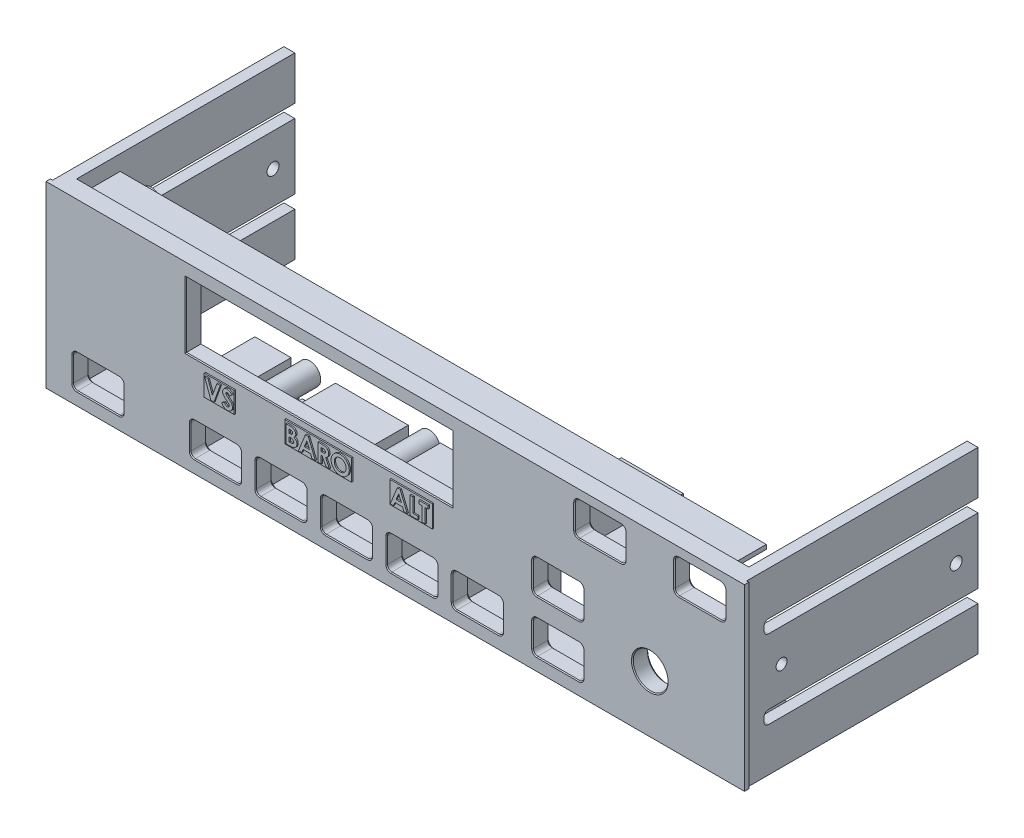
from build123d import *

# Parameters (mm, degrees)
ESQUISSE1_W              = 160
ESQUISSE1_H              = 41
BOSS_EXTRU_1_DEPTH       = 4
ESQUISSE2_R              = 4
ENL_V_MAT_EXTRU_1_DEPTH  = 4
ESQUISSE4_W              = 3
ESQUISSE4_H              = 41
BOSS_EXTRU_2_DEPTH       = 50
ENL_V_MAT_EXTRU_2_DEPTH  = 173.571724219
CHANFREIN1_SIZE          = 0.2
ESQUISSE9_R              = 1.25
ESQUISSE9_R_2            = 1.375
ENL_V_MAT_EXTRU_3_DEPTH  = 900
ENL_V_START              = -1
ESQUISSE10_W             = 4.171279912
ESQUISSE10_H             = 57.921201065
ESQUISSE10_W_2           = 8.342559824
ESQUISSE10_H_2           = 64.595248924
ENL_V_MAT_EXTRU_5_DEPTH  = 173.772840225
ESQUISSE11_W             = 14.2
ESQUISSE11_H             = 13.6
ESQUISSE11_W_2           = 12.8
ESQUISSE11_H_2           = 12.2
BOSS_EXTRU_4_DEPTH       = 8
ESQUISSE7_R              = 2.5
ESQUISSE7_R_2            = 1.25
BOSS_EXTRU_3_DEPTH       = 11
ESQUISSE7_3_R            = 2.5
ESQUISSE7_3_R_2          = 1.25
BOSS_EXTRU_12_DEPTH      = 10.5
ESQUISSE12_W             = 148
ESQUISSE12_H             = 1
BOSS_EXTRU_5_DEPTH       = 7
ESQUISSE14_W             = 8.279282425
ESQUISSE14_H             = 6.197970863
ESQUISSE14_W_2           = 6.879282425
ESQUISSE14_H_2           = 4.797970863
ESQUISSE14_W_3           = 16.678738338
ESQUISSE14_H_3           = 6.241410903
ESQUISSE14_W_4           = 15.278738338
ESQUISSE14_H_4           = 4.841410903
ESQUISSE14_W_5           = 11.14782764
ESQUISSE14_H_5           = 6.395979727
ESQUISSE14_W_6           = 9.74782764
ESQUISSE14_H_6           = 4.995979727
BOSS_EXTRU_7_DEPTH       = 8
ESQUISSE15_W             = 9.74782764
ESQUISSE15_H             = 4.995979727
ESQUISSE15_W_2           = 15.278738338
ESQUISSE15_H_2           = 4.841410903
ESQUISSE15_W_3           = 6.879282425
ESQUISSE15_H_3           = 4.797970863
ENL_V_MAT_EXTRU_7_DEPTH  = 3.7
CHANFREIN2_SIZE          = 0.5
ESQUISSE16_W             = 6.879282425
ESQUISSE16_H             = 4.797970863
ESQUISSE16_W_2           = 15.278738338
ESQUISSE16_H_2           = 4.841410903
ESQUISSE16_W_3           = 9.74782764
ESQUISSE16_H_3           = 4.995979727
BOSS_EXTRU_10_DEPTH      = 0.3
ESQUISSE16_3_W           = 6.879282425
ESQUISSE16_3_H           = 4.797970863
ESQUISSE16_3_W_2         = 15.278738338
ESQUISSE16_3_H_2         = 4.841410903
ESQUISSE16_3_W_3         = 9.74782764
ESQUISSE16_3_H_3         = 4.995979727
ENL_V_MAT_EXTRU_10_DEPTH = 0.3
BOSS_EXTRU_11_DEPTH      = 0.3
ENL_V_MAT_EXTRU_11_DEPTH = 0.3


with BuildPart() as part:
    # Esquisse1 → Boss.-Extru.1 (new body)
    with BuildSketch(Plane.XY):
        with Locations((80, 20.5)):
            Rectangle(ESQUISSE1_W, ESQUISSE1_H)
    extrude(amount=BOSS_EXTRU_1_DEPTH)

    # Esquisse2 → Enlèv. mat.-Extru.1 (cut)
    with BuildSketch(Plane.XY.offset(4)):
        with Locations((138.32, 13)):
            Circle(ESQUISSE2_R)
        with BuildLine():
            Line((7.1, 2.95), (16.7, 2.95))
            ThreePointArc((16.7, 2.95), (17.407106781, 3.242893219), (17.7, 3.95))
            Line((17.7, 3.95), (17.7, 9.55))
            ThreePointArc((17.7, 9.55), (17.407106781, 10.257106781), (16.7, 10.55))
            Line((16.7, 10.55), (7.1, 10.55))
            ThreePointArc((7.1, 10.55), (6.392893219, 10.257106781), (6.1, 9.55))
            Line((6.1, 9.55), (6.1, 3.95))
            ThreePointArc((6.1, 3.95), (6.392893219, 3.242893219), (7.1, 2.95))
        make_face()
        with BuildLine():
            Line((49.030194036, 10.55), (58.630194036, 10.55))
            ThreePointArc((58.630194036, 10.55), (59.337300817, 10.257106781), (59.630194036, 9.55))
            Line((59.630194036, 9.55), (59.630194036, 3.95))
            ThreePointArc((59.630194036, 3.95), (59.337300817, 3.242893219), (58.630194036, 2.95))
            Line((58.630194036, 2.95), (49.030194036, 2.95))
            ThreePointArc((49.030194036, 2.95), (48.323087255, 3.242893219), (48.030194036, 3.95))
            Line((48.030194036, 3.95), (48.030194036, 9.55))
            ThreePointArc((48.030194036, 9.55), (48.323087255, 10.257106781), (49.030194036, 10.55))
        make_face()
        with BuildLine():
            Line((34.030194036, 10.55), (43.630194036, 10.55))
            ThreePointArc((43.630194036, 10.55), (44.337300817, 10.257106781), (44.630194036, 9.55))
            Line((44.630194036, 9.55), (44.630194036, 3.95))
            ThreePointArc((44.630194036, 3.95), (44.337300817, 3.242893219), (43.630194036, 2.95))
            Line((43.630194036, 2.95), (34.030194036, 2.95))
            ThreePointArc((34.030194036, 2.95), (33.323087255, 3.242893219), (33.030194036, 3.95))
            Line((33.030194036, 3.95), (33.030194036, 9.55))
            ThreePointArc((33.030194036, 9.55), (33.323087255, 10.257106781), (34.030194036, 10.55))
        make_face()
        with BuildLine():
            Line((64.030194036, 10.55), (73.630194036, 10.55))
            ThreePointArc((73.630194036, 10.55), (74.337300817, 10.257106781), (74.630194036, 9.55))
            Line((74.630194036, 9.55), (74.630194036, 3.95))
            ThreePointArc((74.630194036, 3.95), (74.337300817, 3.242893219), (73.630194036, 2.95))
            Line((73.630194036, 2.95), (64.030194036, 2.95))
            ThreePointArc((64.030194036, 2.95), (63.323087255, 3.242893219), (63.030194036, 3.95))
            Line((63.030194036, 3.95), (63.030194036, 9.55))
            ThreePointArc((63.030194036, 9.55), (63.323087255, 10.257106781), (64.030194036, 10.55))
        make_face()
        with BuildLine():
            Line((79.030194036, 10.55), (88.630194036, 10.55))
            ThreePointArc((88.630194036, 10.55), (89.337300817, 10.257106781), (89.630194036, 9.55))
            Line((89.630194036, 9.55), (89.630194036, 3.95))
            ThreePointArc((89.630194036, 3.95), (89.337300817, 3.242893219), (88.630194036, 2.95))
            Line((88.630194036, 2.95), (79.030194036, 2.95))
            ThreePointArc((79.030194036, 2.95), (78.323087255, 3.242893219), (78.030194036, 3.95))
            Line((78.030194036, 3.95), (78.030194036, 9.55))
            ThreePointArc((78.030194036, 9.55), (78.323087255, 10.257106781), (79.030194036, 10.55))
        make_face()
        with BuildLine():
            Line((112.45409437, 10.55), (122.05409437, 10.55))
            ThreePointArc((122.05409437, 10.55), (122.761201151, 10.257106781), (123.05409437, 9.55))
            Line((123.05409437, 9.55), (123.05409437, 3.95))
            ThreePointArc((123.05409437, 3.95), (122.761201151, 3.242893219), (122.05409437, 2.95))
            Line((122.05409437, 2.95), (112.45409437, 2.95))
            ThreePointArc((112.45409437, 2.95), (111.746987589, 3.242893219), (111.45409437, 3.95))
            Line((111.45409437, 3.95), (111.45409437, 9.55))
            ThreePointArc((111.45409437, 9.55), (111.746987589, 10.257106781), (112.45409437, 10.55))
        make_face()
        with BuildLine():
            Line((122.089585492, 31.2), (131.689585492, 31.2))
            ThreePointArc((131.689585492, 31.2), (132.396692273, 31.492893219), (132.689585492, 32.2))
            Line((132.689585492, 32.2), (132.689585492, 37.8))
            ThreePointArc((132.689585492, 37.8), (132.396692273, 38.507106781), (131.689585492, 38.8))
            Line((131.689585492, 38.8), (122.089585492, 38.8))
            ThreePointArc((122.089585492, 38.8), (121.382478711, 38.507106781), (121.089585492, 37.8))
            Line((121.089585492, 37.8), (121.089585492, 32.2))
            ThreePointArc((121.089585492, 32.2), (121.382478711, 31.492893219), (122.089585492, 31.2))
        make_face()
        with BuildLine():
            Line((144.95, 31.2), (154.55, 31.2))
            ThreePointArc((154.55, 31.2), (155.257106781, 31.492893219), (155.55, 32.2))
            Line((155.55, 32.2), (155.55, 37.8))
            ThreePointArc((155.55, 37.8), (155.257106781, 38.507106781), (154.55, 38.8))
            Line((154.55, 38.8), (144.95, 38.8))
            ThreePointArc((144.95, 38.8), (144.242893219, 38.507106781), (143.95, 37.8))
            Line((143.95, 37.8), (143.95, 32.2))
            ThreePointArc((143.95, 32.2), (144.242893219, 31.492893219), (144.95, 31.2))
        make_face()
        with BuildLine():
            Line((112.45409437, 22.55), (122.05409437, 22.55))
            ThreePointArc((122.05409437, 22.55), (122.761201151, 22.257106781), (123.05409437, 21.55))
            Line((123.05409437, 21.55), (123.05409437, 15.95))
            ThreePointArc((123.05409437, 15.95), (122.761201151, 15.242893219), (122.05409437, 14.95))
            Line((122.05409437, 14.95), (112.45409437, 14.95))
            ThreePointArc((112.45409437, 14.95), (111.746987589, 15.242893219), (111.45409437, 15.95))
            Line((111.45409437, 15.95), (111.45409437, 21.55))
            ThreePointArc((111.45409437, 21.55), (111.746987589, 22.257106781), (112.45409437, 22.55))
        make_face()
        Polygon((32, 38), (63.5, 38), (93, 38), (93, 23), (63.5, 23), (32, 23), align=None)
        with BuildLine():
            Line((94.030194036, 10.55), (103.630194036, 10.55))
            ThreePointArc((103.630194036, 10.55), (104.337300817, 10.257106781), (104.630194036, 9.55))
            Line((104.630194036, 9.55), (104.630194036, 3.95))
            ThreePointArc((104.630194036, 3.95), (104.337300817, 3.242893219), (103.630194036, 2.95))
            Line((103.630194036, 2.95), (94.030194036, 2.95))
            ThreePointArc((94.030194036, 2.95), (93.323087255, 3.242893219), (93.030194036, 3.95))
            Line((93.030194036, 3.95), (93.030194036, 9.55))
            ThreePointArc((93.030194036, 9.55), (93.323087255, 10.257106781), (94.030194036, 10.55))
        make_face()
    extrude(amount=-ENL_V_MAT_EXTRU_1_DEPTH, mode=Mode.SUBTRACT)

    # Esquisse4 → Boss.-Extru.2 (add)
    with BuildSketch(Plane(origin=(0, 0, 0), x_dir=(-1, 0, 0), z_dir=(0, 0, -1))):
        with Locations((-158.5, 20.5)):
            Rectangle(ESQUISSE4_W, ESQUISSE4_H)
        with Locations((-1.5, 20.5)):
            Rectangle(ESQUISSE4_W, ESQUISSE4_H)
    extrude(amount=BOSS_EXTRU_2_DEPTH)

    # Esquisse5 → Enlèv. mat.-Extru.2 (cut, through all)
    with BuildSketch(Plane(origin=(160, 0, 0), x_dir=(0, 0, -1), z_dir=(1, 0, 0))):
        with BuildLine():
            Line((50, 13), (2, 13))
            ThreePointArc((2, 13), (1.292893219, 12.707106781), (1, 12))
            Line((1, 12), (1, 11))
            ThreePointArc((1, 11), (1.292893219, 10.292893219), (2, 10))
            Line((2, 10), (50, 10))
            Line((50, 10), (50, 13))
        make_face()
        with BuildLine():
            Line((50, 31), (2, 31))
            ThreePointArc((2, 31), (1.292893219, 30.707106781), (1, 30))
            Line((1, 30), (1, 29))
            ThreePointArc((1, 29), (1.292893219, 28.292893219), (2, 28))
            Line((2, 28), (50, 28))
            Line((50, 28), (50, 31))
        make_face()
    extrude(amount=-ENL_V_MAT_EXTRU_2_DEPTH, mode=Mode.SUBTRACT)

    # Chanfrein1
    chanfrein1_edges = [part.edges().sort_by_distance(p)[0] for p in [
        (93, 30.5, 4),
        (62.5, 23, 4),
        (32, 30.5, 4),
        (62.5, 38, 4),
        (149.75, 31.2, 4),
        (155.257106781, 31.492893219, 4),
        (144.242893219, 31.492893219, 4),
        (155.55, 35, 4),
        (143.95, 35, 4),
        (155.257106781, 38.507106781, 4),
        (144.242893219, 38.507106781, 4),
        (149.75, 38.8, 4),
        (126.889585492, 31.2, 4),
        (132.396692273, 31.492893219, 4),
        (121.382478711, 31.492893219, 4),
        (132.689585492, 35, 4),
        (121.089585492, 35, 4),
        (132.396692273, 38.507106781, 4),
        (121.382478711, 38.507106781, 4),
        (126.889585492, 38.8, 4),
        (11.9, 2.95, 4),
        (17.407106781, 3.242893219, 4),
        (6.392893219, 3.242893219, 4),
        (17.7, 6.75, 4),
        (6.1, 6.75, 4),
        (17.407106781, 10.257106781, 4),
        (6.392893219, 10.257106781, 4),
        (11.9, 10.55, 4),
        (134.32, 13, 4),
        (123.05409437, 18.75, 4),
        (122.761201151, 22.257106781, 4),
        (122.761201151, 15.242893219, 4),
        (117.25409437, 22.55, 4),
        (117.25409437, 14.95, 4),
        (111.746987589, 22.257106781, 4),
        (111.746987589, 15.242893219, 4),
        (111.45409437, 18.75, 4),
        (123.05409437, 6.75, 4),
        (122.761201151, 10.257106781, 4),
        (122.761201151, 3.242893219, 4),
        (117.25409437, 10.55, 4),
        (117.25409437, 2.95, 4),
        (111.746987589, 10.257106781, 4),
        (111.746987589, 3.242893219, 4),
        (111.45409437, 6.75, 4),
        (104.630194036, 6.75, 4),
        (104.337300817, 10.257106781, 4),
        (104.337300817, 3.242893219, 4),
        (98.830194036, 10.55, 4),
        (98.830194036, 2.95, 4),
        (93.323087255, 10.257106781, 4),
        (93.323087255, 3.242893219, 4),
        (93.030194036, 6.75, 4),
        (89.630194036, 6.75, 4),
        (89.337300817, 10.257106781, 4),
        (89.337300817, 3.242893219, 4),
        (83.830194036, 10.55, 4),
        (83.830194036, 2.95, 4),
        (78.323087255, 10.257106781, 4),
        (78.323087255, 3.242893219, 4),
        (78.030194036, 6.75, 4),
        (74.630194036, 6.75, 4),
        (74.337300817, 10.257106781, 4),
        (74.337300817, 3.242893219, 4),
        (68.830194036, 10.55, 4),
        (68.830194036, 2.95, 4),
        (63.323087255, 10.257106781, 4),
        (63.323087255, 3.242893219, 4),
        (63.030194036, 6.75, 4),
        (59.630194036, 6.75, 4),
        (59.337300817, 10.257106781, 4),
        (59.337300817, 3.242893219, 4),
        (53.830194036, 10.55, 4),
        (53.830194036, 2.95, 4),
        (48.323087255, 10.257106781, 4),
        (48.323087255, 3.242893219, 4),
        (48.030194036, 6.75, 4),
        (44.630194036, 6.75, 4),
        (44.337300817, 10.257106781, 4),
        (44.337300817, 3.242893219, 4),
        (38.830194036, 10.55, 4),
        (38.830194036, 2.95, 4),
        (33.323087255, 10.257106781, 4),
        (33.323087255, 3.242893219, 4),
        (33.030194036, 6.75, 4),
    ]]
    chamfer(chanfrein1_edges, length=CHANFREIN1_SIZE)

    # Esquisse9 → Enlèv. mat.-Extru.3 (cut)
    with BuildSketch(Plane(origin=(160, 0, 0), x_dir=(0, 0, -1), z_dir=(1, 0, 0))):
        with Locations((5, 20.5)):
            Circle(ESQUISSE9_R)
        with Locations((45, 20.5)):
            Circle(ESQUISSE9_R_2)
    extrude(amount=-ENL_V_MAT_EXTRU_3_DEPTH, mode=Mode.SUBTRACT)

    # Esquisse10 → Enlèv. mat.-Extru.5 (cut, through all)
    with BuildSketch(Plane.XY.offset(4).offset(ENL_V_START)):
        with Locations((-1.585639956, 24.108169502)):
            Rectangle(ESQUISSE10_W, ESQUISSE10_H)
        with Locations((163.671279912, 22.797195815)):
            Rectangle(ESQUISSE10_W_2, ESQUISSE10_H_2)
    extrude(amount=-ENL_V_MAT_EXTRU_5_DEPTH, mode=Mode.SUBTRACT)

    # Esquisse11 → Boss.-Extru.4 (add)
    # profile 1 of 7: a face of its own
    with BuildSketch(Plane(origin=(0, 0, 0), x_dir=(-1, 0, 0), z_dir=(0, 0, -1))):
        with Locations((-11.9, 8.45)):
            Rectangle(ESQUISSE11_W, ESQUISSE11_H)
        with Locations((-11.9, 8.45)):
            Rectangle(ESQUISSE11_W_2, ESQUISSE11_H_2, mode=Mode.SUBTRACT)
    # profile 2 of 7: a face of its own
    with BuildSketch(Plane(origin=(0, 0, 0), x_dir=(-1, 0, 0), z_dir=(0, 0, -1))):
        with Locations((-38.830194036, 8.45)):
            Rectangle(ESQUISSE11_W, ESQUISSE11_H)
        with Locations((-38.830194036, 8.45)):
            Rectangle(ESQUISSE11_W_2, ESQUISSE11_H_2, mode=Mode.SUBTRACT)
    # profile 3 of 7: a face of its own
    with BuildSketch(Plane(origin=(0, 0, 0), x_dir=(-1, 0, 0), z_dir=(0, 0, -1))):
        with Locations((-53.830194036, 8.45)):
            Rectangle(ESQUISSE11_W, ESQUISSE11_H)
        with Locations((-53.830194036, 8.45)):
            Rectangle(ESQUISSE11_W_2, ESQUISSE11_H_2, mode=Mode.SUBTRACT)
    # profile 4 of 7: a face of its own
    with BuildSketch(Plane(origin=(0, 0, 0), x_dir=(-1, 0, 0), z_dir=(0, 0, -1))):
        with Locations((-68.830194036, 8.45)):
            Rectangle(ESQUISSE11_W, ESQUISSE11_H)
        with Locations((-68.830194036, 8.45)):
            Rectangle(ESQUISSE11_W_2, ESQUISSE11_H_2, mode=Mode.SUBTRACT)
    # profile 5 of 7: a face of its own
    with BuildSketch(Plane(origin=(0, 0, 0), x_dir=(-1, 0, 0), z_dir=(0, 0, -1))):
        with Locations((-83.830194036, 8.45)):
            Rectangle(ESQUISSE11_W, ESQUISSE11_H)
        with Locations((-83.830194036, 8.45)):
            Rectangle(ESQUISSE11_W_2, ESQUISSE11_H_2, mode=Mode.SUBTRACT)
    # profile 6 of 7: a face of its own
    with BuildSketch(Plane(origin=(0, 0, 0), x_dir=(-1, 0, 0), z_dir=(0, 0, -1))):
        with Locations((-98.830194036, 8.45)):
            Rectangle(ESQUISSE11_W, ESQUISSE11_H)
        with Locations((-98.830194036, 8.45)):
            Rectangle(ESQUISSE11_W_2, ESQUISSE11_H_2, mode=Mode.SUBTRACT)
    # profile 7 of 7: a face of its own
    with BuildSketch(Plane(origin=(0, 0, 0), x_dir=(-1, 0, 0), z_dir=(0, 0, -1))):
        with Locations((-126.889585492, 33.3)):
            Rectangle(ESQUISSE11_W, ESQUISSE11_H)
        with Locations((-126.889585492, 33.3)):
            Rectangle(ESQUISSE11_W_2, ESQUISSE11_H_2, mode=Mode.SUBTRACT)
    extrude(amount=BOSS_EXTRU_4_DEPTH)

    # Esquisse7 → Boss.-Extru.3 (add)
    # profile 1 of 4: a face of its own
    with BuildSketch(Plane(origin=(0, 0, 0), x_dir=(-1, 0, 0), z_dir=(0, 0, -1))):
        with Locations((-9.121504758, 34.424873109)):
            Circle(ESQUISSE7_R)
        with Locations((-9.121504758, 34.424873109)):
            Circle(ESQUISSE7_R_2, mode=Mode.SUBTRACT)
    # profile 2 of 4: a face of its own
    with BuildSketch(Plane(origin=(0, 0, 0), x_dir=(-1, 0, 0), z_dir=(0, 0, -1))):
        with Locations((-24.98168427, 6.75)):
            Circle(ESQUISSE7_R)
        with Locations((-24.98168427, 6.75)):
            Circle(ESQUISSE7_R_2, mode=Mode.SUBTRACT)
    # profile 3 of 4: a face of its own
    with BuildSketch(Plane(origin=(0, 0, 0), x_dir=(-1, 0, 0), z_dir=(0, 0, -1))):
        with Locations((-138.246159037, 33.067084724)):
            Circle(ESQUISSE7_R)
        with Locations((-138.246159037, 33.067084724)):
            Circle(ESQUISSE7_R_2, mode=Mode.SUBTRACT)
    # profile 4 of 4: a face of its own
    with BuildSketch(Plane(origin=(0, 0, 0), x_dir=(-1, 0, 0), z_dir=(0, 0, -1))):
        with Locations((-152.183195484, 6.75)):
            Circle(ESQUISSE7_R)
        with Locations((-152.183195484, 6.75)):
            Circle(ESQUISSE7_R_2, mode=Mode.SUBTRACT)
    extrude(amount=BOSS_EXTRU_3_DEPTH)

    # Esquisse7<3> → Boss.-Extru.12 (add)
    # profile 1 of 7: a face of its own
    with BuildSketch(Plane(origin=(0, 0, 0), x_dir=(-1, 0, 0), z_dir=(0, 0, -1))):
        with Locations((-9.121504758, 34.424873109)):
            Circle(ESQUISSE7_3_R)
        with Locations((-9.121504758, 34.424873109)):
            Circle(ESQUISSE7_3_R_2, mode=Mode.SUBTRACT)
    # profile 2 of 7: a face of its own
    with BuildSketch(Plane(origin=(0, 0, 0), x_dir=(-1, 0, 0), z_dir=(0, 0, -1))):
        with Locations((-24.98168427, 6.75)):
            Circle(ESQUISSE7_3_R)
        with Locations((-24.98168427, 6.75)):
            Circle(ESQUISSE7_3_R_2, mode=Mode.SUBTRACT)
    # profile 3 of 7: a face of its own
    with BuildSketch(Plane(origin=(0, 0, 0), x_dir=(-1, 0, 0), z_dir=(0, 0, -1))):
        with Locations((-138.246159037, 33.067084724)):
            Circle(ESQUISSE7_3_R)
        with Locations((-138.246159037, 33.067084724)):
            Circle(ESQUISSE7_3_R_2, mode=Mode.SUBTRACT)
    # profile 4 of 7: a face of its own
    with BuildSketch(Plane(origin=(0, 0, 0), x_dir=(-1, 0, 0), z_dir=(0, 0, -1))):
        with Locations((-152.183195484, 6.75)):
            Circle(ESQUISSE7_3_R)
        with Locations((-152.183195484, 6.75)):
            Circle(ESQUISSE7_3_R_2, mode=Mode.SUBTRACT)
    # profile 5 of 7: a face of its own
    with BuildSketch(Plane(origin=(0, 0, 0), x_dir=(-1, 0, 0), z_dir=(0, 0, -1))):
        with Locations((-73.299586821, 18.635920155)):
            Circle(ESQUISSE7_3_R)
        with Locations((-73.299586821, 18.635920155)):
            Circle(ESQUISSE7_3_R_2, mode=Mode.SUBTRACT)
    # profile 6 of 7: a face of its own
    with BuildSketch(Plane(origin=(0, 0, 0), x_dir=(-1, 0, 0), z_dir=(0, 0, -1))):
        with Locations((-103.528260194, 18.635920155)):
            Circle(ESQUISSE7_3_R)
        with Locations((-103.528260194, 18.635920155)):
            Circle(ESQUISSE7_3_R_2, mode=Mode.SUBTRACT)
    # profile 7 of 7: a face of its own
    with BuildSketch(Plane(origin=(0, 0, 0), x_dir=(-1, 0, 0), z_dir=(0, 0, -1))):
        with Locations((-45.928753513, 18.635920155)):
            Circle(ESQUISSE7_3_R)
        with Locations((-45.928753513, 18.635920155)):
            Circle(ESQUISSE7_3_R_2, mode=Mode.SUBTRACT)
    extrude(amount=BOSS_EXTRU_12_DEPTH)

    # Esquisse12 → Boss.-Extru.5 (add)
    with BuildSketch(Plane(origin=(0, 0, 0), x_dir=(-1, 0, 0), z_dir=(0, 0, -1))):
        with Locations((-80, 40)):
            Rectangle(ESQUISSE12_W, ESQUISSE12_H)
        with Locations((-80, 1)):
            Rectangle(ESQUISSE12_W, ESQUISSE12_H)
    extrude(amount=BOSS_EXTRU_5_DEPTH)

    # Esquisse14 → Boss.-Extru.7 (add)
    # profile 1 of 3: a face of its own
    with BuildSketch(Plane(origin=(0, 0, 0), x_dir=(-1, 0, 0), z_dir=(0, 0, -1))):
        with Locations((-39.983624666, 19.009843626)):
            Rectangle(ESQUISSE14_W, ESQUISSE14_H)
        with Locations((-39.983624666, 19.009843626)):
            Rectangle(ESQUISSE14_W_2, ESQUISSE14_H_2, mode=Mode.SUBTRACT)
    # profile 2 of 3: a face of its own
    with BuildSketch(Plane(origin=(0, 0, 0), x_dir=(-1, 0, 0), z_dir=(0, 0, -1))):
        with Locations((-62.664411353, 19.031563646)):
            Rectangle(ESQUISSE14_W_3, ESQUISSE14_H_3)
        with Locations((-62.664411353, 19.031563646)):
            Rectangle(ESQUISSE14_W_4, ESQUISSE14_H_4, mode=Mode.SUBTRACT)
    # profile 3 of 3: a face of its own
    with BuildSketch(Plane(origin=(0, 0, 0), x_dir=(-1, 0, 0), z_dir=(0, 0, -1))):
        with Locations((-83.939853259, 19.108848058)):
            Rectangle(ESQUISSE14_W_5, ESQUISSE14_H_5)
        with Locations((-83.939853259, 19.108848058)):
            Rectangle(ESQUISSE14_W_6, ESQUISSE14_H_6, mode=Mode.SUBTRACT)
    extrude(amount=BOSS_EXTRU_7_DEPTH)

    # Esquisse15 → Enlèv. mat.-Extru.7 (cut)
    with BuildSketch(Plane(origin=(0, 0, 0), x_dir=(-1, 0, 0), z_dir=(0, 0, -1))):
        with Locations((-83.939853259, 19.108848058)):
            Rectangle(ESQUISSE15_W, ESQUISSE15_H)
        with Locations((-62.664411353, 19.031563646)):
            Rectangle(ESQUISSE15_W_2, ESQUISSE15_H_2)
        with Locations((-39.983624666, 19.009843626)):
            Rectangle(ESQUISSE15_W_3, ESQUISSE15_H_3)
    extrude(amount=-ENL_V_MAT_EXTRU_7_DEPTH, mode=Mode.SUBTRACT)

    # Chanfrein2
    chanfrein2_edges = [part.edges().sort_by_distance(p)[0] for p in [
        (32, 30.5, 0),
        (62.5, 38, 0),
        (93, 30.5, 0),
        (62.5, 23, 0),
        (11.9, 2.95, 0),
        (17.407106781, 3.242893219, 0),
        (6.392893219, 3.242893219, 0),
        (17.7, 6.75, 0),
        (6.1, 6.75, 0),
        (17.407106781, 10.257106781, 0),
        (6.392893219, 10.257106781, 0),
        (11.9, 10.55, 0),
        (38.830194036, 2.95, 0),
        (44.337300817, 3.242893219, 0),
        (33.323087255, 3.242893219, 0),
        (44.630194036, 6.75, 0),
        (33.030194036, 6.75, 0),
        (44.337300817, 10.257106781, 0),
        (33.323087255, 10.257106781, 0),
        (38.830194036, 10.55, 0),
        (53.830194036, 2.95, 0),
        (59.337300817, 3.242893219, 0),
        (48.323087255, 3.242893219, 0),
        (59.630194036, 6.75, 0),
        (48.030194036, 6.75, 0),
        (59.337300817, 10.257106781, 0),
        (48.323087255, 10.257106781, 0),
        (53.830194036, 10.55, 0),
        (68.830194036, 2.95, 0),
        (74.337300817, 3.242893219, 0),
        (63.323087255, 3.242893219, 0),
        (74.630194036, 6.75, 0),
        (63.030194036, 6.75, 0),
        (74.337300817, 10.257106781, 0),
        (63.323087255, 10.257106781, 0),
        (68.830194036, 10.55, 0),
        (83.830194036, 2.95, 0),
        (89.337300817, 3.242893219, 0),
        (78.323087255, 3.242893219, 0),
        (89.630194036, 6.75, 0),
        (78.030194036, 6.75, 0),
        (89.337300817, 10.257106781, 0),
        (78.323087255, 10.257106781, 0),
        (83.830194036, 10.55, 0),
        (98.830194036, 10.55, 0),
        (93.323087255, 10.257106781, 0),
        (104.337300817, 10.257106781, 0),
        (93.030194036, 6.75, 0),
        (104.630194036, 6.75, 0),
        (93.323087255, 3.242893219, 0),
        (104.337300817, 3.242893219, 0),
        (98.830194036, 2.95, 0),
        (117.25409437, 10.55, 0),
        (111.746987589, 10.257106781, 0),
        (122.761201151, 10.257106781, 0),
        (111.45409437, 6.75, 0),
        (123.05409437, 6.75, 0),
        (111.746987589, 3.242893219, 0),
        (122.761201151, 3.242893219, 0),
        (117.25409437, 2.95, 0),
        (134.32, 13, 0),
        (117.25409437, 22.55, 0),
        (111.746987589, 22.257106781, 0),
        (122.761201151, 22.257106781, 0),
        (111.45409437, 18.75, 0),
        (123.05409437, 18.75, 0),
        (111.746987589, 15.242893219, 0),
        (122.761201151, 15.242893219, 0),
        (117.25409437, 14.95, 0),
        (126.889585492, 38.8, 0),
        (121.382478711, 38.507106781, 0),
        (132.396692273, 38.507106781, 0),
        (121.089585492, 35, 0),
        (132.689585492, 35, 0),
        (121.382478711, 31.492893219, 0),
        (132.396692273, 31.492893219, 0),
        (126.889585492, 31.2, 0),
        (149.75, 38.8, 0),
        (144.242893219, 38.507106781, 0),
        (155.257106781, 38.507106781, 0),
        (143.95, 35, 0),
        (155.55, 35, 0),
        (144.242893219, 31.492893219, 0),
        (155.257106781, 31.492893219, 0),
        (149.75, 31.2, 0),
    ]]
    chamfer(chanfrein2_edges, length=CHANFREIN2_SIZE)

    # Esquisse16 → Boss.-Extru.10 (add)
    with BuildSketch(Plane.XY.offset(4)):
        with Locations((39.983624666, 19.009843626)):
            Rectangle(ESQUISSE16_W, ESQUISSE16_H)
        with Locations((62.664411353, 19.031563646)):
            Rectangle(ESQUISSE16_W_2, ESQUISSE16_H_2)
        with Locations((83.939853259, 19.108848058)):
            Rectangle(ESQUISSE16_W_3, ESQUISSE16_H_3)
    extrude(amount=BOSS_EXTRU_10_DEPTH)

    # Esquisse16<3> → Enlèv. mat.-Extru.10 (cut)
    with BuildSketch(Plane.XY.offset(4)):
        with Locations((39.983624666, 19.009843626)):
            Rectangle(ESQUISSE16_3_W, ESQUISSE16_3_H)
        with Locations((62.664411353, 19.031563646)):
            Rectangle(ESQUISSE16_3_W_2, ESQUISSE16_3_H_2)
        with Locations((83.939853259, 19.108848058)):
            Rectangle(ESQUISSE16_3_W_3, ESQUISSE16_3_H_3)
    extrude(amount=-ENL_V_MAT_EXTRU_10_DEPTH, mode=Mode.SUBTRACT)


with BuildPart() as enl_v_mat_extru_10_piece_1:
    # of the separate pieces the step leaves, piece 1, a body of its own (enl_v_mat_extru_10_pieces)
    add(part.part.solids().sort_by_distance((33.030194036, 3.95, 0.5))[0])


with BuildPart() as enl_v_mat_extru_10_piece_2:
    # of the separate pieces the step leaves, piece 2, a body of its own (enl_v_mat_extru_10_pieces)
    add(part.part.solids().sort_by_distance((55.025042184, 16.610858194, 4.3))[0])



with BuildPart() as enl_v_mat_extru_10_piece_3:
    # of the separate pieces the step leaves, piece 3, a body of its own (enl_v_mat_extru_10_pieces)
    add(part.part.solids().sort_by_distance((79.065939439, 16.610858194, 4.3))[0])


with BuildPart() as enl_v_mat_extru_10_piece_4:
    # of the separate pieces the step leaves, piece 4, a body of its own (enl_v_mat_extru_10_pieces)
    add(part.part.solids().sort_by_distance((36.543983453, 16.610858194, 4.3))[0])


with BuildPart() as enl_v_mat_extru_10_piece_2_1:
    add(enl_v_mat_extru_10_piece_2.part)

    add(enl_v_mat_extru_10_piece_3.part)  # Boss.-Extru.11 merges Enlèv. mat.-Extru.10 piece 3

    add(enl_v_mat_extru_10_piece_4.part)  # Boss.-Extru.11 merges Enlèv. mat.-Extru.10 piece 4
    # Esquisse13 → Boss.-Extru.11 (add)
    # profile 1 of 9: a face of its own
    with BuildSketch(Plane.XY.offset(4.3)):
        Polygon((36.928205128, 21.061183811), (37.695032051, 21.061183811), (38.723076923, 18.219837658), (39.753525641, 21.061183811), (40.517948718, 21.061183811), (39.067628205, 17.061183811), (38.376121795, 17.061183811), align=None)
    # profile 2 of 9: a face of its own
    with BuildSketch(Plane.XY.offset(4.3)):
        with BuildLine():
            Line((43.21025641, 20.526728683), (42.673397436, 20.035542786))
            add(Edge.make_bspline(
                [(42.673397436, 20.035542786), (42.650400699, 20.067982073), (42.606250172, 20.130260982), (42.534686773, 20.213653908), (42.463446519, 20.28479428), (42.391869413, 20.343384906), (42.319321023, 20.389069805), (42.245927282, 20.421415218), (42.172104279, 20.441977504), (42.122506616, 20.444538003), (42.098076923, 20.445799196)],
                knots=[0, 0, 0, 0, 1.299362458, 2.494594718, 3.587462134, 4.587049575, 5.512617175, 6.380583204, 7.202344345, 8, 8, 8, 8], degree=3))
            add(Edge.make_bspline(
                [(42.098076923, 20.445799196), (42.075289606, 20.445000046), (42.031293283, 20.443457099), (41.968573261, 20.428120311), (41.912889533, 20.401651269), (41.864296442, 20.367040768), (41.825803545, 20.32534314), (41.795069952, 20.281613049), (41.777764356, 20.233344918), (41.775486599, 20.200192419), (41.774358974, 20.183779965)],
                knots=[0, 0, 0, 0, 1.185010067, 2.2879431, 3.333075148, 4.379039566, 5.372662701, 6.27520591, 7.14612461, 8, 8, 8, 8], degree=3))
            add(Edge.make_bspline(
                [(41.774358974, 20.183779965), (41.7750656, 20.167130837), (41.776488645, 20.133601805), (41.790233323, 20.084460834), (41.810950479, 20.036444385), (41.830746567, 20.007214488), (41.840865385, 19.992273555)],
                knots=[0, 0, 0, 0, 0.967525499, 1.948461899, 2.951351359, 4, 4, 4, 4], degree=3))
            add(Edge.make_bspline(
                [(41.840865385, 19.992273555), (41.850064485, 19.980660125), (41.871239598, 19.953927541), (41.911616203, 19.911587297), (41.962320739, 19.859716791), (42.025304423, 19.800099698), (42.097952629, 19.730591956), (42.183632696, 19.653925939), (42.279878378, 19.567727389), (42.348287579, 19.507701841), (42.384134615, 19.476247914)],
                knots=[0, 0, 0, 0, 0.473873513, 1.090794244, 1.870441696, 2.795289791, 3.865433203, 5.087734844, 6.473946851, 8, 8, 8, 8], degree=3))
            add(Edge.make_bspline(
                [(42.384134615, 19.476247914), (42.417782216, 19.447127613), (42.481638371, 19.391863331), (42.572492999, 19.313424557), (42.652339086, 19.242855104), (42.722339806, 19.18121407), (42.781434017, 19.127854698), (42.829870152, 19.082521931), (42.868239774, 19.046098316), (42.890050658, 19.02409843), (42.899358974, 19.014709452)],
                knots=[0, 0, 0, 0, 1.543621617, 2.929473131, 4.163658386, 5.240097082, 6.164993805, 6.925417477, 7.541396219, 8, 8, 8, 8], degree=3))
            add(Edge.make_bspline(
                [(42.899358974, 19.014709452), (42.934672785, 18.976492346), (43.002558331, 18.903025646), (43.09078561, 18.789175366), (43.163399514, 18.678034279), (43.219575007, 18.567511083), (43.262000999, 18.45601115), (43.291911886, 18.34079995), (43.309825715, 18.220673598), (43.311814568, 18.138702028), (43.312820513, 18.097241504)],
                knots=[0, 0, 0, 0, 1.206664779, 2.319633467, 3.337109185, 4.282041471, 5.190008762, 6.099243693, 7.03861361, 8, 8, 8, 8], degree=3))
            add(Edge.make_bspline(
                [(43.312820513, 18.097241504), (43.312104507, 18.056843308), (43.310699677, 17.977580544), (43.293493199, 17.861591295), (43.268957772, 17.750584551), (43.231021698, 17.64576822), (43.184785436, 17.545421775), (43.126821603, 17.451108295), (43.05875103, 17.361873288), (42.980731701, 17.279311939), (42.894433059, 17.204393238), (42.801869563, 17.13769884), (42.702136082, 17.08263412), (42.596084722, 17.03729225), (42.483772251, 17.002369336), (42.365332466, 16.976558048), (42.240584206, 16.961066519), (42.155279548, 16.959447064), (42.111698718, 16.958619709)],
                knots=[0, 0, 0, 0, 1.043214005, 2.046824704, 3.02475056, 3.976699089, 4.921714032, 5.875962561, 6.831408892, 7.817874052, 8.806269674, 9.781291748, 10.760897367, 11.74438705, 12.757449933, 13.795994037, 14.874007457, 16, 16, 16, 16], degree=3))
            add(Edge.make_bspline(
                [(42.111698718, 16.958619709), (42.077488138, 16.959226627), (42.009731569, 16.960428674), (41.90986863, 16.970242385), (41.813439674, 16.986080669), (41.720553319, 17.008781662), (41.630791095, 17.0375469), (41.544149317, 17.072682535), (41.461226101, 17.114733158), (41.381394011, 17.16283404), (41.305041129, 17.2186855), (41.231202003, 17.281145673), (41.160610074, 17.351175225), (41.092926303, 17.428608538), (41.028583749, 17.513664885), (40.965476249, 17.6051597), (40.906408492, 17.704791), (40.869919711, 17.774683164), (40.851282051, 17.810382529)],
                knots=[0, 0, 0, 0, 1.016823716, 2.013894106, 2.979844003, 3.91962641, 4.853723003, 5.779685073, 6.695824784, 7.614987388, 8.547259901, 9.504950863, 10.487499108, 11.500346958, 12.559593716, 13.656357062, 14.802919212, 16, 16, 16, 16], degree=3))
            Line((40.851282051, 17.810382529), (41.482692308, 18.18938894))
            add(Edge.make_bspline(
                [(41.482692308, 18.18938894), (41.506005234, 18.148865495), (41.550698107, 18.071178589), (41.626434357, 17.966796385), (41.704022279, 17.877410305), (41.785255637, 17.804600254), (41.869146661, 17.74739267), (41.956100567, 17.706508161), (42.046178446, 17.681200696), (42.107535405, 17.67811007), (42.138141026, 17.676568427)],
                knots=[0, 0, 0, 0, 1.283663364, 2.460892379, 3.537111102, 4.529833553, 5.449777664, 6.316464042, 7.160231139, 8, 8, 8, 8], degree=3))
            add(Edge.make_bspline(
                [(42.138141026, 17.676568427), (42.169271324, 17.677827416), (42.229668636, 17.680270039), (42.315878071, 17.702831807), (42.394918145, 17.738255438), (42.463239801, 17.788800075), (42.521090272, 17.847136268), (42.56378724, 17.91203795), (42.590609763, 17.982260004), (42.593445554, 18.031040861), (42.594871795, 18.055574837)],
                knots=[0, 0, 0, 0, 1.13588714, 2.203786484, 3.234766741, 4.283437687, 5.291419208, 6.222934724, 7.106237994, 8, 8, 8, 8], degree=3))
            add(Edge.make_bspline(
                [(42.594871795, 18.055574837), (42.59355472, 18.078399709), (42.590879209, 18.124766252), (42.57117222, 18.193705846), (42.540364184, 18.262614088), (42.503916106, 18.319134491), (42.466825622, 18.366457493), (42.431358753, 18.407460734), (42.38816949, 18.452762137), (42.33736734, 18.502418687), (42.279623533, 18.556867524), (42.214889427, 18.616103316), (42.142423748, 18.679604266), (42.091204863, 18.722860486), (42.064423077, 18.745478683)],
                knots=[0, 0, 0, 0, 0.916159276, 1.861089862, 2.860218735, 3.940849679, 4.552606315, 5.27541173, 6.11797699, 7.06649574, 8.129236253, 9.306560635, 10.591630461, 12, 12, 12, 12], degree=3))
            add(Edge.make_bspline(
                [(42.064423077, 18.745478683), (42.013509835, 18.788556168), (41.915791914, 18.871234899), (41.777704094, 18.993348783), (41.653274605, 19.107475396), (41.543578151, 19.215025594), (41.447217032, 19.314013173), (41.364843846, 19.405242148), (41.297363501, 19.489416227), (41.226354988, 19.58911479), (41.158882704, 19.71060434), (41.100567503, 19.856770351), (41.062735063, 20.002917817), (41.058496464, 20.101033176), (41.056410256, 20.149324837)],
                knots=[0, 0, 0, 0, 1.345494975, 2.582412109, 3.71882943, 4.751509156, 5.681369928, 6.505683931, 7.230279997, 7.856715994, 8.973648664, 10.023341002, 11.027102913, 12, 12, 12, 12], degree=3))
            add(Edge.make_bspline(
                [(41.056410256, 20.149324837), (41.057277907, 20.183570691), (41.058987273, 20.251038703), (41.074235075, 20.350240583), (41.097023497, 20.445962062), (41.130118828, 20.537853905), (41.173072572, 20.625801012), (41.225238225, 20.710233923), (41.287425822, 20.790375536), (41.357507045, 20.866172722), (41.43471861, 20.935442725), (41.517228979, 20.996580443), (41.604571137, 21.048218248), (41.696210768, 21.091055558), (41.792715724, 21.123844797), (41.89337506, 21.147087444), (41.998333151, 21.160911429), (42.069723379, 21.162790639), (42.106089744, 21.163747914)],
                knots=[0, 0, 0, 0, 1.010766082, 1.991317756, 2.957454644, 3.913069143, 4.869106762, 5.843196583, 6.838735724, 7.860187025, 8.887984031, 9.89767229, 10.887916223, 11.879572884, 12.879850636, 13.892031539, 14.926195476, 16, 16, 16, 16], degree=3))
            add(Edge.make_bspline(
                [(42.106089744, 21.163747914), (42.153218752, 21.162023834), (42.24710475, 21.158589285), (42.385917905, 21.131732227), (42.521504791, 21.089496676), (42.630763245, 21.03854413), (42.717698158, 20.989186374), (42.784325647, 20.94374397), (42.852122704, 20.891687254), (42.92163607, 20.832852182), (42.991574078, 20.766130222), (43.0639254, 20.693109745), (43.137704163, 20.613159683), (43.18564866, 20.556043729), (43.21025641, 20.526728683)],
                knots=[0, 0, 0, 0, 1.282922637, 2.555718331, 3.837320111, 5.142675274, 5.830281639, 6.55870424, 7.337177975, 8.157850921, 9.037902056, 9.96903443, 10.957596896, 12, 12, 12, 12], degree=3))
        make_face()
    # profile 3 of 9: a face of its own
    with BuildSketch(Plane.XY.offset(4.3)):
        with BuildLine():
            Line((55.561538462, 17.061183811), (55.561538462, 21.061183811))
            Line((55.561538462, 21.061183811), (56.202564103, 21.061183811))
            add(Edge.make_bspline(
                [(56.202564103, 21.061183811), (56.247439906, 21.061188933), (56.334273734, 21.061198843), (56.459552286, 21.056799471), (56.575737563, 21.051108391), (56.682459819, 21.044741397), (56.779900701, 21.033769792), (56.867912036, 21.02220692), (56.94666967, 21.008262808), (56.995361235, 20.995754508), (57.018269231, 20.989869709)],
                knots=[0, 0, 0, 0, 1.311965854, 2.538629056, 3.664479157, 4.713267157, 5.663616078, 6.530575999, 7.308677837, 8, 8, 8, 8], degree=3))
            add(Edge.make_bspline(
                [(57.018269231, 20.989869709), (57.048349755, 20.981569095), (57.107377399, 20.965280625), (57.191923823, 20.932385358), (57.2721279, 20.895819935), (57.347891703, 20.854105627), (57.418750011, 20.806738824), (57.48443354, 20.75334361), (57.546358919, 20.696063266), (57.602327322, 20.633301405), (57.652913536, 20.566981873), (57.696863886, 20.497122047), (57.735051108, 20.42479013), (57.765610887, 20.349075873), (57.788637107, 20.27032796), (57.805478388, 20.188882657), (57.816393819, 20.104482251), (57.817425184, 20.047061897), (57.817948718, 20.017914581)],
                knots=[0, 0, 0, 0, 1.099996261, 2.158545794, 3.195537121, 4.207578794, 5.205712374, 6.197378256, 7.190519799, 8.17788031, 9.159561366, 10.129234751, 11.085776129, 12.040971148, 13.00380137, 13.975669004, 14.972423361, 16, 16, 16, 16], degree=3))
            add(Edge.make_bspline(
                [(57.817948718, 20.017914581), (57.816579831, 19.98046793), (57.813885346, 19.9067588), (57.796672793, 19.798493424), (57.764396574, 19.696167082), (57.722163926, 19.597893938), (57.664740728, 19.504040552), (57.591824373, 19.414651549), (57.504595866, 19.326974508), (57.437686786, 19.274418035), (57.402884615, 19.247081247)],
                knots=[0, 0, 0, 0, 0.986156485, 1.941127874, 2.875419072, 3.804401753, 4.751181392, 5.761612777, 6.835722519, 8, 8, 8, 8], degree=3))
            add(Edge.make_bspline(
                [(57.402884615, 19.247081247), (57.431086625, 19.232684366), (57.486382964, 19.204456065), (57.56488752, 19.158057164), (57.637574169, 19.108706048), (57.704768817, 19.057395682), (57.765061978, 19.001950944), (57.820943259, 18.945566638), (57.869655767, 18.885012175), (57.91321596, 18.822445833), (57.951077771, 18.756961644), (57.984051234, 18.688670196), (58.011902735, 18.61733819), (58.035488107, 18.543328649), (58.053078084, 18.466387014), (58.064547122, 18.386485768), (58.073328535, 18.303897415), (58.074011647, 18.247640291), (58.074358974, 18.219036376)],
                knots=[0, 0, 0, 0, 1.164658916, 2.283573913, 3.35186032, 4.395461096, 5.390182219, 6.362969632, 7.312859996, 8.245001507, 9.165155236, 10.092416118, 11.032087915, 11.979892451, 12.947605196, 13.931445124, 14.948243989, 16, 16, 16, 16], degree=3))
            add(Edge.make_bspline(
                [(58.074358974, 18.219036376), (58.072105049, 18.164404533), (58.067656937, 18.056588811), (58.035134514, 17.898290569), (57.978750965, 17.748209479), (57.903039485, 17.606942025), (57.809748376, 17.47857767), (57.702490352, 17.36613161), (57.582345258, 17.270948516), (57.471496886, 17.206707311), (57.375621775, 17.163595456), (57.296210211, 17.136940988), (57.210923875, 17.11224833), (57.118200525, 17.094908635), (57.01972111, 17.079037439), (56.914525449, 17.069238235), (56.802810151, 17.062597555), (56.726079255, 17.061664587), (56.686538462, 17.061183811)],
                knots=[0, 0, 0, 0, 1.284142165, 2.534249414, 3.780121997, 5.041676246, 6.291546858, 7.49970053, 8.684500223, 9.883330709, 10.50184324, 11.153274765, 11.851151195, 12.587658647, 13.369265475, 14.195992086, 15.070362669, 16, 16, 16, 16], degree=3))
            Line((56.686538462, 17.061183811), (55.561538462, 17.061183811))
        make_face()
        with BuildLine():
            Line((56.279487179, 20.343235093), (56.279487179, 19.471440222))
            Line((56.279487179, 19.471440222), (56.470192308, 19.471440222))
            add(Edge.make_bspline(
                [(56.470192308, 19.471440222), (56.496110848, 19.471666241), (56.546145022, 19.472102558), (56.618414078, 19.477722169), (56.685612629, 19.487309573), (56.747485806, 19.500686414), (56.80460998, 19.517673052), (56.856620224, 19.538111636), (56.903287859, 19.563048929), (56.957504858, 19.600194129), (57.014816136, 19.654854952), (57.065266609, 19.733823837), (57.0949816, 19.824637754), (57.098291049, 19.888686761), (57.1, 19.921760735)],
                knots=[0, 0, 0, 0, 1.065314748, 2.056525647, 2.977365736, 3.853934255, 4.656397591, 5.425096493, 6.14721249, 6.826394842, 8.123232004, 9.372140726, 10.643011755, 12, 12, 12, 12], degree=3))
            add(Edge.make_bspline(
                [(57.1, 19.921760735), (57.098632526, 19.952740006), (57.095988571, 20.012637183), (57.066069395, 20.096738153), (57.019598999, 20.171268825), (56.964734166, 20.222278975), (56.913068264, 20.257117404), (56.868828748, 20.280057026), (56.820272558, 20.300592341), (56.766459697, 20.316294143), (56.707697466, 20.328076222), (56.644271307, 20.336728749), (56.576071787, 20.342618026), (56.528966234, 20.343024992), (56.504647436, 20.343235093)],
                knots=[0, 0, 0, 0, 1.347982417, 2.606269829, 3.849316587, 5.153353503, 5.842674298, 6.568177932, 7.326619318, 8.142485038, 9.012069166, 9.942760135, 10.937925643, 12, 12, 12, 12], degree=3))
            Line((56.504647436, 20.343235093), (56.279487179, 20.343235093))
        make_face(mode=Mode.SUBTRACT)
        with BuildLine():
            Line((56.279487179, 18.804773555), (56.279487179, 17.779132529))
            Line((56.279487179, 17.779132529), (56.486217949, 17.779132529))
            add(Edge.make_bspline(
                [(56.486217949, 17.779132529), (56.527088885, 17.779366024), (56.60566836, 17.779814945), (56.718233319, 17.785238986), (56.820583008, 17.795014864), (56.912446238, 17.807219259), (56.993963717, 17.823754307), (57.064859895, 17.844776501), (57.126107021, 17.867904576), (57.177337855, 17.896470494), (57.219190512, 17.929714139), (57.256958146, 17.963689943), (57.287751522, 18.002884243), (57.312115816, 18.045614535), (57.333203069, 18.09081937), (57.345921411, 18.140263979), (57.35560471, 18.192482943), (57.356137608, 18.228601671), (57.356410256, 18.247081247)],
                knots=[0, 0, 0, 0, 1.753078804, 3.370512758, 4.83203934, 6.162291463, 7.344201807, 8.395507345, 9.331626367, 10.147333109, 10.898971645, 11.62040215, 12.321813352, 13.025280112, 13.727906689, 14.453419512, 15.208716525, 16, 16, 16, 16], degree=3))
            add(Edge.make_bspline(
                [(57.356410256, 18.247081247), (57.355808988, 18.268212934), (57.354637878, 18.309371774), (57.345073409, 18.369529812), (57.327691645, 18.425691332), (57.305798466, 18.47929246), (57.275332943, 18.528414089), (57.239125711, 18.574756131), (57.195378131, 18.616749303), (57.146181425, 18.656933508), (57.088798338, 18.692116957), (57.023201948, 18.722644831), (56.9490359, 18.748140587), (56.866070456, 18.768440325), (56.77466933, 18.785668431), (56.674165395, 18.795955513), (56.565395682, 18.803606468), (56.489972993, 18.804375686), (56.450961538, 18.804773555)],
                knots=[0, 0, 0, 0, 0.845221588, 1.646264278, 2.427170338, 3.19324141, 3.95557735, 4.731569926, 5.540061037, 6.376114724, 7.268642756, 8.224665384, 9.265483498, 10.400594375, 11.639216012, 12.983232105, 14.439614077, 16, 16, 16, 16], degree=3))
            Line((56.450961538, 18.804773555), (56.279487179, 18.804773555))
        make_face(mode=Mode.SUBTRACT)
    # profile 4 of 9: a face of its own
    with BuildSketch(Plane.XY.offset(4.3)):
        Polygon((60.023878205, 21.061183811), (60.68974359, 21.061183811), (62.305128205, 17.061183811), (61.538301282, 17.061183811), (61.227403846, 17.881696632), (59.484615385, 17.881696632), (59.173717949, 17.061183811), (58.407692308, 17.061183811), align=None)
        Polygon((60.356410256, 19.988267145), (59.757051282, 18.59964535), (60.955769231, 18.59964535), align=None, mode=Mode.SUBTRACT)
    # profile 5 of 9: a face of its own
    with BuildSketch(Plane.XY.offset(4.3)):
        with BuildLine():
            Line((62.894871795, 21.061183811), (63.731410256, 21.061183811))
            add(Edge.make_bspline(
                [(63.731410256, 21.061183811), (63.786705194, 21.060987546), (63.893052935, 21.060610073), (64.046400569, 21.054654542), (64.187271459, 21.046366931), (64.315874178, 21.033719818), (64.432153707, 21.016951274), (64.536226586, 20.997183936), (64.628089773, 20.974654817), (64.708518006, 20.946581756), (64.78110051, 20.914915769), (64.848757494, 20.87853097), (64.912981572, 20.837832514), (64.973343477, 20.791749515), (65.030367766, 20.741110996), (65.08416202, 20.685865982), (65.133966075, 20.625546019), (65.179471544, 20.560532254), (65.220946116, 20.492139263), (65.257600939, 20.420273143), (65.287408702, 20.344883917), (65.313747056, 20.26706112), (65.332717719, 20.185692262), (65.345911537, 20.101569481), (65.355571535, 20.014396657), (65.356126939, 19.955175311), (65.356410256, 19.924965863)],
                knots=[0, 0, 0, 0, 1.749336639, 3.364467119, 4.854658419, 6.213483162, 7.451590619, 8.570285859, 9.5643256, 10.440900261, 11.26203566, 12.067320669, 12.869050712, 13.665104639, 14.467235401, 15.27997916, 16.102287765, 16.939272006, 17.78853747, 18.631303466, 19.488103222, 20.351255419, 21.228522269, 22.127379805, 23.044756219, 24, 24, 24, 24], degree=3))
            add(Edge.make_bspline(
                [(65.356410256, 19.924965863), (65.3556743, 19.893434139), (65.354231223, 19.831606175), (65.346458024, 19.740785938), (65.332251059, 19.653895488), (65.310732545, 19.57118923), (65.285999807, 19.491637787), (65.253111609, 19.416708934), (65.215994028, 19.345312938), (65.171910562, 19.278459724), (65.123531111, 19.214664348), (65.067266827, 19.156371046), (65.006762772, 19.100446776), (64.938617792, 19.050394444), (64.865835782, 19.002829691), (64.786970638, 18.959723358), (64.702537063, 18.919991851), (64.643176079, 18.897834818), (64.612820513, 18.886504324)],
                knots=[0, 0, 0, 0, 1.099860209, 2.156625411, 3.176576793, 4.16617041, 5.135385252, 6.078461593, 7.016046972, 7.938469504, 8.868247731, 9.803980173, 10.76021508, 11.73834243, 12.748633912, 13.790971185, 14.870363756, 16, 16, 16, 16], degree=3))
            Line((64.612820513, 18.886504324), (65.535897436, 17.061183811))
            Line((65.535897436, 17.061183811), (64.737820513, 17.061183811))
            Line((64.737820513, 17.061183811), (63.856410256, 18.804773555))
            Line((63.856410256, 18.804773555), (63.612820513, 18.804773555))
            Line((63.612820513, 18.804773555), (63.612820513, 17.061183811))
            Line((63.612820513, 17.061183811), (62.894871795, 17.061183811))
            Line((62.894871795, 17.061183811), (62.894871795, 21.061183811))
        make_face()
        with BuildLine():
            Line((63.612820513, 19.522722273), (63.892467949, 19.522722273))
            add(Edge.make_bspline(
                [(63.892467949, 19.522722273), (63.926657172, 19.523107335), (63.992122189, 19.523844646), (64.086269482, 19.5272646), (64.171777676, 19.535505), (64.249013974, 19.545916436), (64.318367021, 19.557937944), (64.379218212, 19.575165494), (64.432505171, 19.59362525), (64.477596446, 19.616565938), (64.516121396, 19.642654476), (64.549385224, 19.672291703), (64.57689918, 19.70659302), (64.599544568, 19.744626265), (64.617160219, 19.786727833), (64.630018294, 19.832435543), (64.637204056, 19.882270065), (64.638030803, 19.916662671), (64.638461538, 19.934581247)],
                knots=[0, 0, 0, 0, 1.688639943, 3.233382647, 4.650958383, 5.928841754, 7.082724185, 8.122798841, 9.049171256, 9.863274652, 10.613301712, 11.341792392, 12.054588806, 12.776240173, 13.521029143, 14.301969904, 15.115324896, 16, 16, 16, 16], degree=3))
            add(Edge.make_bspline(
                [(64.638461538, 19.934581247), (64.637647193, 19.955780231), (64.636047563, 19.997421707), (64.620174263, 20.057370832), (64.594907399, 20.112857848), (64.560273447, 20.163632051), (64.516656489, 20.208144223), (64.466602587, 20.247382058), (64.409031459, 20.278408401), (64.355724926, 20.298873047), (64.307228442, 20.311117255), (64.263461895, 20.320241531), (64.212779969, 20.326708168), (64.155144404, 20.333567186), (64.090702114, 20.338014913), (64.019101849, 20.341260867), (63.940549246, 20.342588946), (63.885790621, 20.343013509), (63.857211538, 20.343235093)],
                knots=[0, 0, 0, 0, 1.020303359, 2.004196876, 2.966617323, 3.9489082, 4.950758222, 5.960522915, 7.003732012, 8.091992268, 8.70421221, 9.413913587, 10.24622431, 11.166358409, 12.212345909, 13.359657661, 14.621978493, 16, 16, 16, 16], degree=3))
            Line((63.857211538, 20.343235093), (63.612820513, 20.343235093))
            Line((63.612820513, 20.343235093), (63.612820513, 19.522722273))
        make_face(mode=Mode.SUBTRACT)
    # profile 6 of 9: a face of its own
    with BuildSketch(Plane.XY.offset(4.3)):
        with BuildLine():
            add(Edge.make_bspline(
                [(68.005448718, 21.163747914), (68.07499362, 21.161947272), (68.212291009, 21.158392397), (68.414205922, 21.128759737), (68.608788275, 21.080477566), (68.795950078, 21.013361856), (68.975222699, 20.925594773), (69.147238493, 20.819664571), (69.311381308, 20.693571881), (69.465969139, 20.550258238), (69.608836176, 20.394410908), (69.732630546, 20.22661355), (69.838197844, 20.051213962), (69.925692303, 19.867742156), (69.992335619, 19.674927501), (70.03910199, 19.473753098), (70.069147067, 19.26427618), (70.072602713, 19.12165095), (70.074358974, 19.049164581)],
                knots=[0, 0, 0, 0, 1.014329547, 2.002516266, 2.970391464, 3.935626869, 4.897733899, 5.877609409, 6.878433252, 7.912639331, 8.949961323, 9.958554974, 10.949718813, 11.932905612, 12.9188844, 13.919928257, 14.942845884, 16, 16, 16, 16], degree=3))
            add(Edge.make_bspline(
                [(70.074358974, 19.049164581), (70.072488632, 18.977494965), (70.068803061, 18.836267689), (70.040328562, 18.628721182), (69.992774639, 18.429701776), (69.927261646, 18.238758986), (69.841354006, 18.056817673), (69.737845385, 17.882716168), (69.614004389, 17.718070173), (69.474347983, 17.562968044), (69.320598401, 17.422179581), (69.157753186, 17.298109991), (68.986564257, 17.192978102), (68.80728218, 17.106832071), (68.619522492, 17.039977308), (68.423748984, 16.992806415), (68.21997377, 16.964139711), (68.081396742, 16.960478215), (68.011057692, 16.958619709)],
                knots=[0, 0, 0, 0, 1.051557043, 2.072126891, 3.067553643, 4.050577992, 5.02905126, 6.015227836, 7.017913613, 8.04756643, 9.074058332, 10.072836633, 11.047628519, 12.017157415, 12.98668631, 13.966869689, 14.968021931, 16, 16, 16, 16], degree=3))
            add(Edge.make_bspline(
                [(68.011057692, 16.958619709), (67.937491481, 16.96028688), (67.79294393, 16.963562644), (67.581397943, 16.99471366), (67.378718608, 17.041637973), (67.186608549, 17.111669992), (67.003111288, 17.199215904), (66.829575034, 17.307033945), (66.666058107, 17.434945935), (66.513498467, 17.579676001), (66.375279063, 17.738042438), (66.253273327, 17.905342534), (66.150358782, 18.080298265), (66.066531663, 18.262991513), (66.00044573, 18.452286885), (65.953829613, 18.649337243), (65.92629236, 18.853669989), (65.922456581, 18.992456875), (65.920512821, 19.062786376)],
                knots=[0, 0, 0, 0, 1.067978421, 2.098431617, 3.099715153, 4.085208694, 5.062210972, 6.048429807, 7.046490867, 8.072918869, 9.098532598, 10.095778865, 11.076610158, 12.041847152, 13.011192615, 13.984257998, 14.978533688, 16, 16, 16, 16], degree=3))
            add(Edge.make_bspline(
                [(65.920512821, 19.062786376), (65.921122884, 19.110100382), (65.922335288, 19.204129291), (65.936939961, 19.343475334), (65.957966491, 19.480101529), (65.989063732, 19.613463146), (66.026838932, 19.744500989), (66.075782039, 19.871995325), (66.13149254, 19.997308145), (66.196585015, 20.118959346), (66.268961554, 20.235829637), (66.347930801, 20.34736772), (66.433691325, 20.452224935), (66.525966861, 20.551090363), (66.625075404, 20.643314152), (66.729713284, 20.73020186), (66.841909865, 20.80944544), (66.959209518, 20.882980177), (67.080950933, 20.949476365), (67.206638512, 21.006075932), (67.333682843, 21.055503369), (67.463781068, 21.094513688), (67.595538951, 21.126287185), (67.730364059, 21.147299543), (67.867038324, 21.161903812), (67.959202428, 21.163131755), (68.005448718, 21.163747914)],
                knots=[0, 0, 0, 0, 1.034744296, 2.056386356, 3.06226378, 4.057406941, 5.050368692, 6.043467995, 7.042652155, 8.049140477, 9.059438543, 10.048523776, 11.036952808, 12.020949711, 13.004946614, 13.997082645, 14.994316842, 16.007702937, 17.024872941, 18.026463647, 19.021641123, 20.005082605, 20.995858141, 21.984425357, 22.988620895, 24, 24, 24, 24], degree=3))
        make_face()
        with BuildLine():
            add(Edge.make_bspline(
                [(67.994230769, 20.445799196), (67.947427059, 20.444543347), (67.855055265, 20.442064805), (67.719562665, 20.423181662), (67.589484984, 20.393023137), (67.465543294, 20.349338882), (67.347200421, 20.293739912), (67.23424658, 20.226420497), (67.128245948, 20.145066608), (67.027785109, 20.054045772), (66.937035272, 19.952627642), (66.856854928, 19.843940869), (66.789756894, 19.728166956), (66.733561871, 19.606381416), (66.691259473, 19.477214804), (66.661128743, 19.341678894), (66.642087247, 19.199540152), (66.639687042, 19.102644357), (66.638461538, 19.053170991)],
                knots=[0, 0, 0, 0, 1.033739768, 2.040188636, 3.016340934, 3.979330865, 4.937572243, 5.900995986, 6.878200029, 7.884839167, 8.891893314, 9.879764717, 10.863503415, 11.843163062, 12.837761627, 13.859916423, 14.907309254, 16, 16, 16, 16], degree=3))
            add(Edge.make_bspline(
                [(66.638461538, 19.053170991), (66.64008637, 18.998343372), (66.64327077, 18.890890324), (66.665676595, 18.734140712), (66.704010732, 18.586106262), (66.759364481, 18.447510986), (66.828017652, 18.316815889), (66.913273994, 18.195622825), (67.013752758, 18.083206145), (67.091160784, 18.017572605), (67.130448718, 17.984260735)],
                knots=[0, 0, 0, 0, 1.078454662, 2.113592447, 3.107694534, 4.079536787, 5.043276885, 6.005368276, 6.987637804, 8, 8, 8, 8], degree=3))
            add(Edge.make_bspline(
                [(67.130448718, 17.984260735), (67.162633036, 17.959651204), (67.226276555, 17.910986599), (67.327865467, 17.848612925), (67.432482042, 17.795152464), (67.540915744, 17.751957044), (67.652937566, 17.717980253), (67.768532148, 17.694186864), (67.8875357, 17.679254455), (67.968011479, 17.67746975), (68.008653846, 17.676568427)],
                knots=[0, 0, 0, 0, 1.023928204, 2.024787132, 3.009472467, 3.9914905, 4.972207045, 5.96565515, 6.972602802, 8, 8, 8, 8], degree=3))
            add(Edge.make_bspline(
                [(68.008653846, 17.676568427), (68.054652765, 17.677834924), (68.145157085, 17.680326796), (68.278127417, 17.698977477), (68.405517034, 17.730541163), (68.528116781, 17.773842204), (68.645573135, 17.830139267), (68.757312056, 17.899546719), (68.863529451, 17.981212325), (68.963862304, 18.073428464), (69.055571275, 18.175246111), (69.135584299, 18.284512609), (69.204815715, 18.39882049), (69.259842162, 18.519787608), (69.303815832, 18.646272091), (69.333583923, 18.778834111), (69.352786277, 18.916927198), (69.355187157, 19.010904423), (69.356410256, 19.058779965)],
                knots=[0, 0, 0, 0, 1.026359118, 2.019393844, 2.989460624, 3.950973911, 4.916101784, 5.890408035, 6.881132271, 7.902007068, 8.92769091, 9.933912415, 10.920395702, 11.90457117, 12.894218921, 13.903490204, 14.931958862, 16, 16, 16, 16], degree=3))
            add(Edge.make_bspline(
                [(69.356410256, 19.058779965), (69.355144838, 19.10638021), (69.352654055, 19.200074031), (69.333970548, 19.337812082), (69.302607031, 19.469788879), (69.259175961, 19.596219957), (69.203716784, 19.717229264), (69.135135886, 19.832391259), (69.053673909, 19.94159461), (68.961205695, 20.044095137), (68.860559726, 20.138286556), (68.752506223, 20.220027585), (68.640068643, 20.291057941), (68.520667119, 20.346700253), (68.396744507, 20.391030365), (68.267544625, 20.423675696), (68.132578119, 20.44193215), (68.040757615, 20.444498691), (67.994230769, 20.445799196)],
                knots=[0, 0, 0, 0, 1.055025985, 2.07665775, 3.074803781, 4.057872707, 5.035505728, 6.020516407, 7.023567878, 8.050795229, 9.077271434, 10.074415901, 11.050397877, 12.019801805, 12.988065821, 13.964604439, 14.968634123, 16, 16, 16, 16], degree=3))
        make_face(mode=Mode.SUBTRACT)
    # profile 7 of 9: a face of its own
    with BuildSketch(Plane.XY.offset(4.3)):
        Polygon((85.994871795, 21.061183811), (88.148717949, 21.061183811), (88.148717949, 20.343235093), (87.430769231, 20.343235093), (87.430769231, 17.061183811), (86.712820513, 17.061183811), (86.712820513, 20.343235093), (85.994871795, 20.343235093), align=None)
    # profile 8 of 9: a face of its own
    with BuildSketch(Plane.XY.offset(4.3)):
        Polygon((83.943589744, 21.061183811), (84.661538462, 21.061183811), (84.661538462, 17.779132529), (85.78974359, 17.779132529), (85.78974359, 17.061183811), (83.943589744, 17.061183811), align=None)
    # profile 9 of 9: a face of its own
    with BuildSketch(Plane.XY.offset(4.3)):
        Polygon((81.072596154, 21.061183811), (81.738461538, 21.061183811), (83.353846154, 17.061183811), (82.587019231, 17.061183811), (82.276121795, 17.881696632), (80.533333333, 17.881696632), (80.222435897, 17.061183811), (79.456410256, 17.061183811), align=None)
        Polygon((81.405128205, 19.988267145), (80.805769231, 18.59964535), (82.004487179, 18.59964535), align=None, mode=Mode.SUBTRACT)
    extrude(amount=BOSS_EXTRU_11_DEPTH)

    # Esquisse13<3> → Enlèv. mat.-Extru.11 (cut)
    # profile 1 of 9: a face of its own
    with BuildSketch(Plane.XY.offset(4.3)):
        Polygon((36.928205128, 21.061183811), (37.695032051, 21.061183811), (38.723076923, 18.219837658), (39.753525641, 21.061183811), (40.517948718, 21.061183811), (39.067628205, 17.061183811), (38.376121795, 17.061183811), align=None)
    # profile 2 of 9: a face of its own
    with BuildSketch(Plane.XY.offset(4.3)):
        with BuildLine():
            Line((43.21025641, 20.526728683), (42.673397436, 20.035542786))
            add(Edge.make_bspline(
                [(42.673397436, 20.035542786), (42.650400699, 20.067982073), (42.606250172, 20.130260982), (42.534686773, 20.213653908), (42.463446519, 20.28479428), (42.391869413, 20.343384906), (42.319321023, 20.389069805), (42.245927282, 20.421415218), (42.172104279, 20.441977504), (42.122506616, 20.444538003), (42.098076923, 20.445799196)],
                knots=[0, 0, 0, 0, 1.299362458, 2.494594718, 3.587462134, 4.587049575, 5.512617175, 6.380583204, 7.202344345, 8, 8, 8, 8], degree=3))
            add(Edge.make_bspline(
                [(42.098076923, 20.445799196), (42.075289606, 20.445000046), (42.031293283, 20.443457099), (41.968573261, 20.428120311), (41.912889533, 20.401651269), (41.864296442, 20.367040768), (41.825803545, 20.32534314), (41.795069952, 20.281613049), (41.777764356, 20.233344918), (41.775486599, 20.200192419), (41.774358974, 20.183779965)],
                knots=[0, 0, 0, 0, 1.185010067, 2.2879431, 3.333075148, 4.379039566, 5.372662701, 6.27520591, 7.14612461, 8, 8, 8, 8], degree=3))
            add(Edge.make_bspline(
                [(41.774358974, 20.183779965), (41.7750656, 20.167130837), (41.776488645, 20.133601805), (41.790233323, 20.084460834), (41.810950479, 20.036444385), (41.830746567, 20.007214488), (41.840865385, 19.992273555)],
                knots=[0, 0, 0, 0, 0.967525499, 1.948461899, 2.951351359, 4, 4, 4, 4], degree=3))
            add(Edge.make_bspline(
                [(41.840865385, 19.992273555), (41.850064485, 19.980660125), (41.871239598, 19.953927541), (41.911616203, 19.911587297), (41.962320739, 19.859716791), (42.025304423, 19.800099698), (42.097952629, 19.730591956), (42.183632696, 19.653925939), (42.279878378, 19.567727389), (42.348287579, 19.507701841), (42.384134615, 19.476247914)],
                knots=[0, 0, 0, 0, 0.473873513, 1.090794244, 1.870441696, 2.795289791, 3.865433203, 5.087734844, 6.473946851, 8, 8, 8, 8], degree=3))
            add(Edge.make_bspline(
                [(42.384134615, 19.476247914), (42.417782216, 19.447127613), (42.481638371, 19.391863331), (42.572492999, 19.313424557), (42.652339086, 19.242855104), (42.722339806, 19.18121407), (42.781434017, 19.127854698), (42.829870152, 19.082521931), (42.868239774, 19.046098316), (42.890050658, 19.02409843), (42.899358974, 19.014709452)],
                knots=[0, 0, 0, 0, 1.543621617, 2.929473131, 4.163658386, 5.240097082, 6.164993805, 6.925417477, 7.541396219, 8, 8, 8, 8], degree=3))
            add(Edge.make_bspline(
                [(42.899358974, 19.014709452), (42.934672785, 18.976492346), (43.002558331, 18.903025646), (43.09078561, 18.789175366), (43.163399514, 18.678034279), (43.219575007, 18.567511083), (43.262000999, 18.45601115), (43.291911886, 18.34079995), (43.309825715, 18.220673598), (43.311814568, 18.138702028), (43.312820513, 18.097241504)],
                knots=[0, 0, 0, 0, 1.206664779, 2.319633467, 3.337109185, 4.282041471, 5.190008762, 6.099243693, 7.03861361, 8, 8, 8, 8], degree=3))
            add(Edge.make_bspline(
                [(43.312820513, 18.097241504), (43.312104507, 18.056843308), (43.310699677, 17.977580544), (43.293493199, 17.861591295), (43.268957772, 17.750584551), (43.231021698, 17.64576822), (43.184785436, 17.545421775), (43.126821603, 17.451108295), (43.05875103, 17.361873288), (42.980731701, 17.279311939), (42.894433059, 17.204393238), (42.801869563, 17.13769884), (42.702136082, 17.08263412), (42.596084722, 17.03729225), (42.483772251, 17.002369336), (42.365332466, 16.976558048), (42.240584206, 16.961066519), (42.155279548, 16.959447064), (42.111698718, 16.958619709)],
                knots=[0, 0, 0, 0, 1.043214005, 2.046824704, 3.02475056, 3.976699089, 4.921714032, 5.875962561, 6.831408892, 7.817874052, 8.806269674, 9.781291748, 10.760897367, 11.74438705, 12.757449933, 13.795994037, 14.874007457, 16, 16, 16, 16], degree=3))
            add(Edge.make_bspline(
                [(42.111698718, 16.958619709), (42.077488138, 16.959226627), (42.009731569, 16.960428674), (41.90986863, 16.970242385), (41.813439674, 16.986080669), (41.720553319, 17.008781662), (41.630791095, 17.0375469), (41.544149317, 17.072682535), (41.461226101, 17.114733158), (41.381394011, 17.16283404), (41.305041129, 17.2186855), (41.231202003, 17.281145673), (41.160610074, 17.351175225), (41.092926303, 17.428608538), (41.028583749, 17.513664885), (40.965476249, 17.6051597), (40.906408492, 17.704791), (40.869919711, 17.774683164), (40.851282051, 17.810382529)],
                knots=[0, 0, 0, 0, 1.016823716, 2.013894106, 2.979844003, 3.91962641, 4.853723003, 5.779685073, 6.695824784, 7.614987388, 8.547259901, 9.504950863, 10.487499108, 11.500346958, 12.559593716, 13.656357062, 14.802919212, 16, 16, 16, 16], degree=3))
            Line((40.851282051, 17.810382529), (41.482692308, 18.18938894))
            add(Edge.make_bspline(
                [(41.482692308, 18.18938894), (41.506005234, 18.148865495), (41.550698107, 18.071178589), (41.626434357, 17.966796385), (41.704022279, 17.877410305), (41.785255637, 17.804600254), (41.869146661, 17.74739267), (41.956100567, 17.706508161), (42.046178446, 17.681200696), (42.107535405, 17.67811007), (42.138141026, 17.676568427)],
                knots=[0, 0, 0, 0, 1.283663364, 2.460892379, 3.537111102, 4.529833553, 5.449777664, 6.316464042, 7.160231139, 8, 8, 8, 8], degree=3))
            add(Edge.make_bspline(
                [(42.138141026, 17.676568427), (42.169271324, 17.677827416), (42.229668636, 17.680270039), (42.315878071, 17.702831807), (42.394918145, 17.738255438), (42.463239801, 17.788800075), (42.521090272, 17.847136268), (42.56378724, 17.91203795), (42.590609763, 17.982260004), (42.593445554, 18.031040861), (42.594871795, 18.055574837)],
                knots=[0, 0, 0, 0, 1.13588714, 2.203786484, 3.234766741, 4.283437687, 5.291419208, 6.222934724, 7.106237994, 8, 8, 8, 8], degree=3))
            add(Edge.make_bspline(
                [(42.594871795, 18.055574837), (42.59355472, 18.078399709), (42.590879209, 18.124766252), (42.57117222, 18.193705846), (42.540364184, 18.262614088), (42.503916106, 18.319134491), (42.466825622, 18.366457493), (42.431358753, 18.407460734), (42.38816949, 18.452762137), (42.33736734, 18.502418687), (42.279623533, 18.556867524), (42.214889427, 18.616103316), (42.142423748, 18.679604266), (42.091204863, 18.722860486), (42.064423077, 18.745478683)],
                knots=[0, 0, 0, 0, 0.916159276, 1.861089862, 2.860218735, 3.940849679, 4.552606315, 5.27541173, 6.11797699, 7.06649574, 8.129236253, 9.306560635, 10.591630461, 12, 12, 12, 12], degree=3))
            add(Edge.make_bspline(
                [(42.064423077, 18.745478683), (42.013509835, 18.788556168), (41.915791914, 18.871234899), (41.777704094, 18.993348783), (41.653274605, 19.107475396), (41.543578151, 19.215025594), (41.447217032, 19.314013173), (41.364843846, 19.405242148), (41.297363501, 19.489416227), (41.226354988, 19.58911479), (41.158882704, 19.71060434), (41.100567503, 19.856770351), (41.062735063, 20.002917817), (41.058496464, 20.101033176), (41.056410256, 20.149324837)],
                knots=[0, 0, 0, 0, 1.345494975, 2.582412109, 3.71882943, 4.751509156, 5.681369928, 6.505683931, 7.230279997, 7.856715994, 8.973648664, 10.023341002, 11.027102913, 12, 12, 12, 12], degree=3))
            add(Edge.make_bspline(
                [(41.056410256, 20.149324837), (41.057277907, 20.183570691), (41.058987273, 20.251038703), (41.074235075, 20.350240583), (41.097023497, 20.445962062), (41.130118828, 20.537853905), (41.173072572, 20.625801012), (41.225238225, 20.710233923), (41.287425822, 20.790375536), (41.357507045, 20.866172722), (41.43471861, 20.935442725), (41.517228979, 20.996580443), (41.604571137, 21.048218248), (41.696210768, 21.091055558), (41.792715724, 21.123844797), (41.89337506, 21.147087444), (41.998333151, 21.160911429), (42.069723379, 21.162790639), (42.106089744, 21.163747914)],
                knots=[0, 0, 0, 0, 1.010766082, 1.991317756, 2.957454644, 3.913069143, 4.869106762, 5.843196583, 6.838735724, 7.860187025, 8.887984031, 9.89767229, 10.887916223, 11.879572884, 12.879850636, 13.892031539, 14.926195476, 16, 16, 16, 16], degree=3))
            add(Edge.make_bspline(
                [(42.106089744, 21.163747914), (42.153218752, 21.162023834), (42.24710475, 21.158589285), (42.385917905, 21.131732227), (42.521504791, 21.089496676), (42.630763245, 21.03854413), (42.717698158, 20.989186374), (42.784325647, 20.94374397), (42.852122704, 20.891687254), (42.92163607, 20.832852182), (42.991574078, 20.766130222), (43.0639254, 20.693109745), (43.137704163, 20.613159683), (43.18564866, 20.556043729), (43.21025641, 20.526728683)],
                knots=[0, 0, 0, 0, 1.282922637, 2.555718331, 3.837320111, 5.142675274, 5.830281639, 6.55870424, 7.337177975, 8.157850921, 9.037902056, 9.96903443, 10.957596896, 12, 12, 12, 12], degree=3))
        make_face()
    # profile 3 of 9: a face of its own
    with BuildSketch(Plane.XY.offset(4.3)):
        with BuildLine():
            Line((55.561538462, 17.061183811), (55.561538462, 21.061183811))
            Line((55.561538462, 21.061183811), (56.202564103, 21.061183811))
            add(Edge.make_bspline(
                [(56.202564103, 21.061183811), (56.247439906, 21.061188933), (56.334273734, 21.061198843), (56.459552286, 21.056799471), (56.575737563, 21.051108391), (56.682459819, 21.044741397), (56.779900701, 21.033769792), (56.867912036, 21.02220692), (56.94666967, 21.008262808), (56.995361235, 20.995754508), (57.018269231, 20.989869709)],
                knots=[0, 0, 0, 0, 1.311965854, 2.538629056, 3.664479157, 4.713267157, 5.663616078, 6.530575999, 7.308677837, 8, 8, 8, 8], degree=3))
            add(Edge.make_bspline(
                [(57.018269231, 20.989869709), (57.048349755, 20.981569095), (57.107377399, 20.965280625), (57.191923823, 20.932385358), (57.2721279, 20.895819935), (57.347891703, 20.854105627), (57.418750011, 20.806738824), (57.48443354, 20.75334361), (57.546358919, 20.696063266), (57.602327322, 20.633301405), (57.652913536, 20.566981873), (57.696863886, 20.497122047), (57.735051108, 20.42479013), (57.765610887, 20.349075873), (57.788637107, 20.27032796), (57.805478388, 20.188882657), (57.816393819, 20.104482251), (57.817425184, 20.047061897), (57.817948718, 20.017914581)],
                knots=[0, 0, 0, 0, 1.099996261, 2.158545794, 3.195537121, 4.207578794, 5.205712374, 6.197378256, 7.190519799, 8.17788031, 9.159561366, 10.129234751, 11.085776129, 12.040971148, 13.00380137, 13.975669004, 14.972423361, 16, 16, 16, 16], degree=3))
            add(Edge.make_bspline(
                [(57.817948718, 20.017914581), (57.816579831, 19.98046793), (57.813885346, 19.9067588), (57.796672793, 19.798493424), (57.764396574, 19.696167082), (57.722163926, 19.597893938), (57.664740728, 19.504040552), (57.591824373, 19.414651549), (57.504595866, 19.326974508), (57.437686786, 19.274418035), (57.402884615, 19.247081247)],
                knots=[0, 0, 0, 0, 0.986156485, 1.941127874, 2.875419072, 3.804401753, 4.751181392, 5.761612777, 6.835722519, 8, 8, 8, 8], degree=3))
            add(Edge.make_bspline(
                [(57.402884615, 19.247081247), (57.431086625, 19.232684366), (57.486382964, 19.204456065), (57.56488752, 19.158057164), (57.637574169, 19.108706048), (57.704768817, 19.057395682), (57.765061978, 19.001950944), (57.820943259, 18.945566638), (57.869655767, 18.885012175), (57.91321596, 18.822445833), (57.951077771, 18.756961644), (57.984051234, 18.688670196), (58.011902735, 18.61733819), (58.035488107, 18.543328649), (58.053078084, 18.466387014), (58.064547122, 18.386485768), (58.073328535, 18.303897415), (58.074011647, 18.247640291), (58.074358974, 18.219036376)],
                knots=[0, 0, 0, 0, 1.164658916, 2.283573913, 3.35186032, 4.395461096, 5.390182219, 6.362969632, 7.312859996, 8.245001507, 9.165155236, 10.092416118, 11.032087915, 11.979892451, 12.947605196, 13.931445124, 14.948243989, 16, 16, 16, 16], degree=3))
            add(Edge.make_bspline(
                [(58.074358974, 18.219036376), (58.072105049, 18.164404533), (58.067656937, 18.056588811), (58.035134514, 17.898290569), (57.978750965, 17.748209479), (57.903039485, 17.606942025), (57.809748376, 17.47857767), (57.702490352, 17.36613161), (57.582345258, 17.270948516), (57.471496886, 17.206707311), (57.375621775, 17.163595456), (57.296210211, 17.136940988), (57.210923875, 17.11224833), (57.118200525, 17.094908635), (57.01972111, 17.079037439), (56.914525449, 17.069238235), (56.802810151, 17.062597555), (56.726079255, 17.061664587), (56.686538462, 17.061183811)],
                knots=[0, 0, 0, 0, 1.284142165, 2.534249414, 3.780121997, 5.041676246, 6.291546858, 7.49970053, 8.684500223, 9.883330709, 10.50184324, 11.153274765, 11.851151195, 12.587658647, 13.369265475, 14.195992086, 15.070362669, 16, 16, 16, 16], degree=3))
            Line((56.686538462, 17.061183811), (55.561538462, 17.061183811))
        make_face()
        with BuildLine():
            Line((56.279487179, 20.343235093), (56.279487179, 19.471440222))
            Line((56.279487179, 19.471440222), (56.470192308, 19.471440222))
            add(Edge.make_bspline(
                [(56.470192308, 19.471440222), (56.496110848, 19.471666241), (56.546145022, 19.472102558), (56.618414078, 19.477722169), (56.685612629, 19.487309573), (56.747485806, 19.500686414), (56.80460998, 19.517673052), (56.856620224, 19.538111636), (56.903287859, 19.563048929), (56.957504858, 19.600194129), (57.014816136, 19.654854952), (57.065266609, 19.733823837), (57.0949816, 19.824637754), (57.098291049, 19.888686761), (57.1, 19.921760735)],
                knots=[0, 0, 0, 0, 1.065314748, 2.056525647, 2.977365736, 3.853934255, 4.656397591, 5.425096493, 6.14721249, 6.826394842, 8.123232004, 9.372140726, 10.643011755, 12, 12, 12, 12], degree=3))
            add(Edge.make_bspline(
                [(57.1, 19.921760735), (57.098632526, 19.952740006), (57.095988571, 20.012637183), (57.066069395, 20.096738153), (57.019598999, 20.171268825), (56.964734166, 20.222278975), (56.913068264, 20.257117404), (56.868828748, 20.280057026), (56.820272558, 20.300592341), (56.766459697, 20.316294143), (56.707697466, 20.328076222), (56.644271307, 20.336728749), (56.576071787, 20.342618026), (56.528966234, 20.343024992), (56.504647436, 20.343235093)],
                knots=[0, 0, 0, 0, 1.347982417, 2.606269829, 3.849316587, 5.153353503, 5.842674298, 6.568177932, 7.326619318, 8.142485038, 9.012069166, 9.942760135, 10.937925643, 12, 12, 12, 12], degree=3))
            Line((56.504647436, 20.343235093), (56.279487179, 20.343235093))
        make_face(mode=Mode.SUBTRACT)
        with BuildLine():
            Line((56.279487179, 18.804773555), (56.279487179, 17.779132529))
            Line((56.279487179, 17.779132529), (56.486217949, 17.779132529))
            add(Edge.make_bspline(
                [(56.486217949, 17.779132529), (56.527088885, 17.779366024), (56.60566836, 17.779814945), (56.718233319, 17.785238986), (56.820583008, 17.795014864), (56.912446238, 17.807219259), (56.993963717, 17.823754307), (57.064859895, 17.844776501), (57.126107021, 17.867904576), (57.177337855, 17.896470494), (57.219190512, 17.929714139), (57.256958146, 17.963689943), (57.287751522, 18.002884243), (57.312115816, 18.045614535), (57.333203069, 18.09081937), (57.345921411, 18.140263979), (57.35560471, 18.192482943), (57.356137608, 18.228601671), (57.356410256, 18.247081247)],
                knots=[0, 0, 0, 0, 1.753078804, 3.370512758, 4.83203934, 6.162291463, 7.344201807, 8.395507345, 9.331626367, 10.147333109, 10.898971645, 11.62040215, 12.321813352, 13.025280112, 13.727906689, 14.453419512, 15.208716525, 16, 16, 16, 16], degree=3))
            add(Edge.make_bspline(
                [(57.356410256, 18.247081247), (57.355808988, 18.268212934), (57.354637878, 18.309371774), (57.345073409, 18.369529812), (57.327691645, 18.425691332), (57.305798466, 18.47929246), (57.275332943, 18.528414089), (57.239125711, 18.574756131), (57.195378131, 18.616749303), (57.146181425, 18.656933508), (57.088798338, 18.692116957), (57.023201948, 18.722644831), (56.9490359, 18.748140587), (56.866070456, 18.768440325), (56.77466933, 18.785668431), (56.674165395, 18.795955513), (56.565395682, 18.803606468), (56.489972993, 18.804375686), (56.450961538, 18.804773555)],
                knots=[0, 0, 0, 0, 0.845221588, 1.646264278, 2.427170338, 3.19324141, 3.95557735, 4.731569926, 5.540061037, 6.376114724, 7.268642756, 8.224665384, 9.265483498, 10.400594375, 11.639216012, 12.983232105, 14.439614077, 16, 16, 16, 16], degree=3))
            Line((56.450961538, 18.804773555), (56.279487179, 18.804773555))
        make_face(mode=Mode.SUBTRACT)
    # profile 4 of 9: a face of its own
    with BuildSketch(Plane.XY.offset(4.3)):
        Polygon((60.023878205, 21.061183811), (60.68974359, 21.061183811), (62.305128205, 17.061183811), (61.538301282, 17.061183811), (61.227403846, 17.881696632), (59.484615385, 17.881696632), (59.173717949, 17.061183811), (58.407692308, 17.061183811), align=None)
        Polygon((60.356410256, 19.988267145), (59.757051282, 18.59964535), (60.955769231, 18.59964535), align=None, mode=Mode.SUBTRACT)
    # profile 5 of 9: a face of its own
    with BuildSketch(Plane.XY.offset(4.3)):
        with BuildLine():
            Line((62.894871795, 21.061183811), (63.731410256, 21.061183811))
            add(Edge.make_bspline(
                [(63.731410256, 21.061183811), (63.786705194, 21.060987546), (63.893052935, 21.060610073), (64.046400569, 21.054654542), (64.187271459, 21.046366931), (64.315874178, 21.033719818), (64.432153707, 21.016951274), (64.536226586, 20.997183936), (64.628089773, 20.974654817), (64.708518006, 20.946581756), (64.78110051, 20.914915769), (64.848757494, 20.87853097), (64.912981572, 20.837832514), (64.973343477, 20.791749515), (65.030367766, 20.741110996), (65.08416202, 20.685865982), (65.133966075, 20.625546019), (65.179471544, 20.560532254), (65.220946116, 20.492139263), (65.257600939, 20.420273143), (65.287408702, 20.344883917), (65.313747056, 20.26706112), (65.332717719, 20.185692262), (65.345911537, 20.101569481), (65.355571535, 20.014396657), (65.356126939, 19.955175311), (65.356410256, 19.924965863)],
                knots=[0, 0, 0, 0, 1.749336639, 3.364467119, 4.854658419, 6.213483162, 7.451590619, 8.570285859, 9.5643256, 10.440900261, 11.26203566, 12.067320669, 12.869050712, 13.665104639, 14.467235401, 15.27997916, 16.102287765, 16.939272006, 17.78853747, 18.631303466, 19.488103222, 20.351255419, 21.228522269, 22.127379805, 23.044756219, 24, 24, 24, 24], degree=3))
            add(Edge.make_bspline(
                [(65.356410256, 19.924965863), (65.3556743, 19.893434139), (65.354231223, 19.831606175), (65.346458024, 19.740785938), (65.332251059, 19.653895488), (65.310732545, 19.57118923), (65.285999807, 19.491637787), (65.253111609, 19.416708934), (65.215994028, 19.345312938), (65.171910562, 19.278459724), (65.123531111, 19.214664348), (65.067266827, 19.156371046), (65.006762772, 19.100446776), (64.938617792, 19.050394444), (64.865835782, 19.002829691), (64.786970638, 18.959723358), (64.702537063, 18.919991851), (64.643176079, 18.897834818), (64.612820513, 18.886504324)],
                knots=[0, 0, 0, 0, 1.099860209, 2.156625411, 3.176576793, 4.16617041, 5.135385252, 6.078461593, 7.016046972, 7.938469504, 8.868247731, 9.803980173, 10.76021508, 11.73834243, 12.748633912, 13.790971185, 14.870363756, 16, 16, 16, 16], degree=3))
            Line((64.612820513, 18.886504324), (65.535897436, 17.061183811))
            Line((65.535897436, 17.061183811), (64.737820513, 17.061183811))
            Line((64.737820513, 17.061183811), (63.856410256, 18.804773555))
            Line((63.856410256, 18.804773555), (63.612820513, 18.804773555))
            Line((63.612820513, 18.804773555), (63.612820513, 17.061183811))
            Line((63.612820513, 17.061183811), (62.894871795, 17.061183811))
            Line((62.894871795, 17.061183811), (62.894871795, 21.061183811))
        make_face()
        with BuildLine():
            Line((63.612820513, 19.522722273), (63.892467949, 19.522722273))
            add(Edge.make_bspline(
                [(63.892467949, 19.522722273), (63.926657172, 19.523107335), (63.992122189, 19.523844646), (64.086269482, 19.5272646), (64.171777676, 19.535505), (64.249013974, 19.545916436), (64.318367021, 19.557937944), (64.379218212, 19.575165494), (64.432505171, 19.59362525), (64.477596446, 19.616565938), (64.516121396, 19.642654476), (64.549385224, 19.672291703), (64.57689918, 19.70659302), (64.599544568, 19.744626265), (64.617160219, 19.786727833), (64.630018294, 19.832435543), (64.637204056, 19.882270065), (64.638030803, 19.916662671), (64.638461538, 19.934581247)],
                knots=[0, 0, 0, 0, 1.688639943, 3.233382647, 4.650958383, 5.928841754, 7.082724185, 8.122798841, 9.049171256, 9.863274652, 10.613301712, 11.341792392, 12.054588806, 12.776240173, 13.521029143, 14.301969904, 15.115324896, 16, 16, 16, 16], degree=3))
            add(Edge.make_bspline(
                [(64.638461538, 19.934581247), (64.637647193, 19.955780231), (64.636047563, 19.997421707), (64.620174263, 20.057370832), (64.594907399, 20.112857848), (64.560273447, 20.163632051), (64.516656489, 20.208144223), (64.466602587, 20.247382058), (64.409031459, 20.278408401), (64.355724926, 20.298873047), (64.307228442, 20.311117255), (64.263461895, 20.320241531), (64.212779969, 20.326708168), (64.155144404, 20.333567186), (64.090702114, 20.338014913), (64.019101849, 20.341260867), (63.940549246, 20.342588946), (63.885790621, 20.343013509), (63.857211538, 20.343235093)],
                knots=[0, 0, 0, 0, 1.020303359, 2.004196876, 2.966617323, 3.9489082, 4.950758222, 5.960522915, 7.003732012, 8.091992268, 8.70421221, 9.413913587, 10.24622431, 11.166358409, 12.212345909, 13.359657661, 14.621978493, 16, 16, 16, 16], degree=3))
            Line((63.857211538, 20.343235093), (63.612820513, 20.343235093))
            Line((63.612820513, 20.343235093), (63.612820513, 19.522722273))
        make_face(mode=Mode.SUBTRACT)
    # profile 6 of 9: a face of its own
    with BuildSketch(Plane.XY.offset(4.3)):
        with BuildLine():
            add(Edge.make_bspline(
                [(68.005448718, 21.163747914), (68.07499362, 21.161947272), (68.212291009, 21.158392397), (68.414205922, 21.128759737), (68.608788275, 21.080477566), (68.795950078, 21.013361856), (68.975222699, 20.925594773), (69.147238493, 20.819664571), (69.311381308, 20.693571881), (69.465969139, 20.550258238), (69.608836176, 20.394410908), (69.732630546, 20.22661355), (69.838197844, 20.051213962), (69.925692303, 19.867742156), (69.992335619, 19.674927501), (70.03910199, 19.473753098), (70.069147067, 19.26427618), (70.072602713, 19.12165095), (70.074358974, 19.049164581)],
                knots=[0, 0, 0, 0, 1.014329547, 2.002516266, 2.970391464, 3.935626869, 4.897733899, 5.877609409, 6.878433252, 7.912639331, 8.949961323, 9.958554974, 10.949718813, 11.932905612, 12.9188844, 13.919928257, 14.942845884, 16, 16, 16, 16], degree=3))
            add(Edge.make_bspline(
                [(70.074358974, 19.049164581), (70.072488632, 18.977494965), (70.068803061, 18.836267689), (70.040328562, 18.628721182), (69.992774639, 18.429701776), (69.927261646, 18.238758986), (69.841354006, 18.056817673), (69.737845385, 17.882716168), (69.614004389, 17.718070173), (69.474347983, 17.562968044), (69.320598401, 17.422179581), (69.157753186, 17.298109991), (68.986564257, 17.192978102), (68.80728218, 17.106832071), (68.619522492, 17.039977308), (68.423748984, 16.992806415), (68.21997377, 16.964139711), (68.081396742, 16.960478215), (68.011057692, 16.958619709)],
                knots=[0, 0, 0, 0, 1.051557043, 2.072126891, 3.067553643, 4.050577992, 5.02905126, 6.015227836, 7.017913613, 8.04756643, 9.074058332, 10.072836633, 11.047628519, 12.017157415, 12.98668631, 13.966869689, 14.968021931, 16, 16, 16, 16], degree=3))
            add(Edge.make_bspline(
                [(68.011057692, 16.958619709), (67.937491481, 16.96028688), (67.79294393, 16.963562644), (67.581397943, 16.99471366), (67.378718608, 17.041637973), (67.186608549, 17.111669992), (67.003111288, 17.199215904), (66.829575034, 17.307033945), (66.666058107, 17.434945935), (66.513498467, 17.579676001), (66.375279063, 17.738042438), (66.253273327, 17.905342534), (66.150358782, 18.080298265), (66.066531663, 18.262991513), (66.00044573, 18.452286885), (65.953829613, 18.649337243), (65.92629236, 18.853669989), (65.922456581, 18.992456875), (65.920512821, 19.062786376)],
                knots=[0, 0, 0, 0, 1.067978421, 2.098431617, 3.099715153, 4.085208694, 5.062210972, 6.048429807, 7.046490867, 8.072918869, 9.098532598, 10.095778865, 11.076610158, 12.041847152, 13.011192615, 13.984257998, 14.978533688, 16, 16, 16, 16], degree=3))
            add(Edge.make_bspline(
                [(65.920512821, 19.062786376), (65.921122884, 19.110100382), (65.922335288, 19.204129291), (65.936939961, 19.343475334), (65.957966491, 19.480101529), (65.989063732, 19.613463146), (66.026838932, 19.744500989), (66.075782039, 19.871995325), (66.13149254, 19.997308145), (66.196585015, 20.118959346), (66.268961554, 20.235829637), (66.347930801, 20.34736772), (66.433691325, 20.452224935), (66.525966861, 20.551090363), (66.625075404, 20.643314152), (66.729713284, 20.73020186), (66.841909865, 20.80944544), (66.959209518, 20.882980177), (67.080950933, 20.949476365), (67.206638512, 21.006075932), (67.333682843, 21.055503369), (67.463781068, 21.094513688), (67.595538951, 21.126287185), (67.730364059, 21.147299543), (67.867038324, 21.161903812), (67.959202428, 21.163131755), (68.005448718, 21.163747914)],
                knots=[0, 0, 0, 0, 1.034744296, 2.056386356, 3.06226378, 4.057406941, 5.050368692, 6.043467995, 7.042652155, 8.049140477, 9.059438543, 10.048523776, 11.036952808, 12.020949711, 13.004946614, 13.997082645, 14.994316842, 16.007702937, 17.024872941, 18.026463647, 19.021641123, 20.005082605, 20.995858141, 21.984425357, 22.988620895, 24, 24, 24, 24], degree=3))
        make_face()
        with BuildLine():
            add(Edge.make_bspline(
                [(67.994230769, 20.445799196), (67.947427059, 20.444543347), (67.855055265, 20.442064805), (67.719562665, 20.423181662), (67.589484984, 20.393023137), (67.465543294, 20.349338882), (67.347200421, 20.293739912), (67.23424658, 20.226420497), (67.128245948, 20.145066608), (67.027785109, 20.054045772), (66.937035272, 19.952627642), (66.856854928, 19.843940869), (66.789756894, 19.728166956), (66.733561871, 19.606381416), (66.691259473, 19.477214804), (66.661128743, 19.341678894), (66.642087247, 19.199540152), (66.639687042, 19.102644357), (66.638461538, 19.053170991)],
                knots=[0, 0, 0, 0, 1.033739768, 2.040188636, 3.016340934, 3.979330865, 4.937572243, 5.900995986, 6.878200029, 7.884839167, 8.891893314, 9.879764717, 10.863503415, 11.843163062, 12.837761627, 13.859916423, 14.907309254, 16, 16, 16, 16], degree=3))
            add(Edge.make_bspline(
                [(66.638461538, 19.053170991), (66.64008637, 18.998343372), (66.64327077, 18.890890324), (66.665676595, 18.734140712), (66.704010732, 18.586106262), (66.759364481, 18.447510986), (66.828017652, 18.316815889), (66.913273994, 18.195622825), (67.013752758, 18.083206145), (67.091160784, 18.017572605), (67.130448718, 17.984260735)],
                knots=[0, 0, 0, 0, 1.078454662, 2.113592447, 3.107694534, 4.079536787, 5.043276885, 6.005368276, 6.987637804, 8, 8, 8, 8], degree=3))
            add(Edge.make_bspline(
                [(67.130448718, 17.984260735), (67.162633036, 17.959651204), (67.226276555, 17.910986599), (67.327865467, 17.848612925), (67.432482042, 17.795152464), (67.540915744, 17.751957044), (67.652937566, 17.717980253), (67.768532148, 17.694186864), (67.8875357, 17.679254455), (67.968011479, 17.67746975), (68.008653846, 17.676568427)],
                knots=[0, 0, 0, 0, 1.023928204, 2.024787132, 3.009472467, 3.9914905, 4.972207045, 5.96565515, 6.972602802, 8, 8, 8, 8], degree=3))
            add(Edge.make_bspline(
                [(68.008653846, 17.676568427), (68.054652765, 17.677834924), (68.145157085, 17.680326796), (68.278127417, 17.698977477), (68.405517034, 17.730541163), (68.528116781, 17.773842204), (68.645573135, 17.830139267), (68.757312056, 17.899546719), (68.863529451, 17.981212325), (68.963862304, 18.073428464), (69.055571275, 18.175246111), (69.135584299, 18.284512609), (69.204815715, 18.39882049), (69.259842162, 18.519787608), (69.303815832, 18.646272091), (69.333583923, 18.778834111), (69.352786277, 18.916927198), (69.355187157, 19.010904423), (69.356410256, 19.058779965)],
                knots=[0, 0, 0, 0, 1.026359118, 2.019393844, 2.989460624, 3.950973911, 4.916101784, 5.890408035, 6.881132271, 7.902007068, 8.92769091, 9.933912415, 10.920395702, 11.90457117, 12.894218921, 13.903490204, 14.931958862, 16, 16, 16, 16], degree=3))
            add(Edge.make_bspline(
                [(69.356410256, 19.058779965), (69.355144838, 19.10638021), (69.352654055, 19.200074031), (69.333970548, 19.337812082), (69.302607031, 19.469788879), (69.259175961, 19.596219957), (69.203716784, 19.717229264), (69.135135886, 19.832391259), (69.053673909, 19.94159461), (68.961205695, 20.044095137), (68.860559726, 20.138286556), (68.752506223, 20.220027585), (68.640068643, 20.291057941), (68.520667119, 20.346700253), (68.396744507, 20.391030365), (68.267544625, 20.423675696), (68.132578119, 20.44193215), (68.040757615, 20.444498691), (67.994230769, 20.445799196)],
                knots=[0, 0, 0, 0, 1.055025985, 2.07665775, 3.074803781, 4.057872707, 5.035505728, 6.020516407, 7.023567878, 8.050795229, 9.077271434, 10.074415901, 11.050397877, 12.019801805, 12.988065821, 13.964604439, 14.968634123, 16, 16, 16, 16], degree=3))
        make_face(mode=Mode.SUBTRACT)
    # profile 7 of 9: a face of its own
    with BuildSketch(Plane.XY.offset(4.3)):
        Polygon((85.994871795, 21.061183811), (88.148717949, 21.061183811), (88.148717949, 20.343235093), (87.430769231, 20.343235093), (87.430769231, 17.061183811), (86.712820513, 17.061183811), (86.712820513, 20.343235093), (85.994871795, 20.343235093), align=None)
    # profile 8 of 9: a face of its own
    with BuildSketch(Plane.XY.offset(4.3)):
        Polygon((83.943589744, 21.061183811), (84.661538462, 21.061183811), (84.661538462, 17.779132529), (85.78974359, 17.779132529), (85.78974359, 17.061183811), (83.943589744, 17.061183811), align=None)
    # profile 9 of 9: a face of its own
    with BuildSketch(Plane.XY.offset(4.3)):
        Polygon((81.072596154, 21.061183811), (81.738461538, 21.061183811), (83.353846154, 17.061183811), (82.587019231, 17.061183811), (82.276121795, 17.881696632), (80.533333333, 17.881696632), (80.222435897, 17.061183811), (79.456410256, 17.061183811), align=None)
        Polygon((81.405128205, 19.988267145), (80.805769231, 18.59964535), (82.004487179, 18.59964535), align=None, mode=Mode.SUBTRACT)
    extrude(amount=-ENL_V_MAT_EXTRU_11_DEPTH, mode=Mode.SUBTRACT)


solid = Compound([enl_v_mat_extru_10_piece_1.part, enl_v_mat_extru_10_piece_2_1.part])
